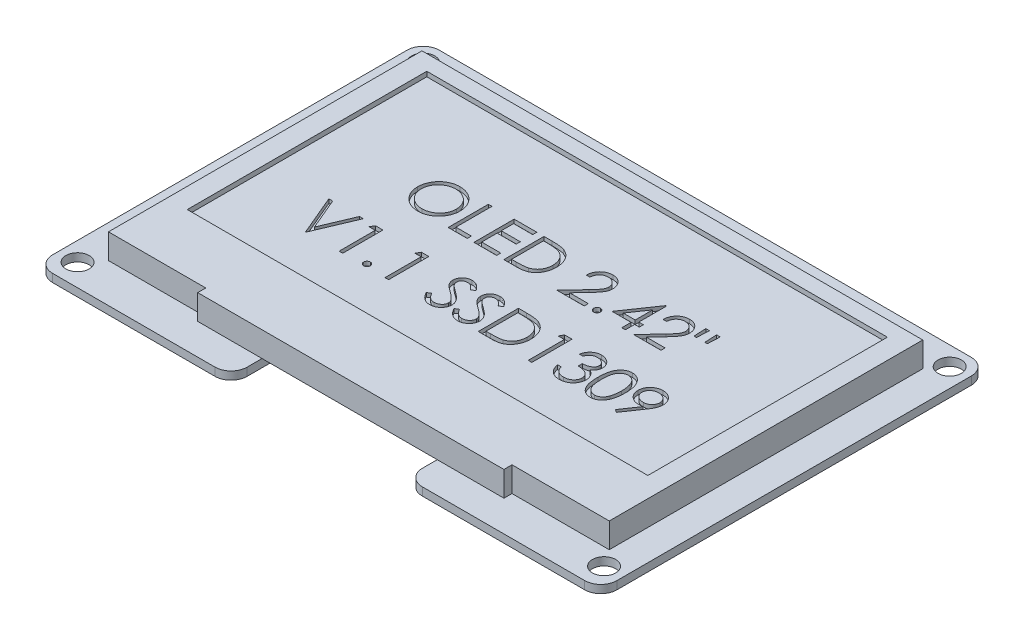
from build123d import *

# Parameters (mm, degrees)
BOSS_EXTRUDE1_DEPTH = 1
BOSS_EXTRUDE2_DEPTH = 3.1
CUT_EXTRUDE1_REACH  = 44.662
SKETCH3_R           = 1.45
SKETCH4_W           = 17.6
SKETCH4_H           = 4.6
BOSS_EXTRUDE3_DEPTH = 2
BOSS_EXTRUDE4_DEPTH = 2
SKETCH6_W           = 57.3
SKETCH6_H           = 29.8
CUT_EXTRUDE2_DEPTH  = 0.6
CUT_EXTRUDE3_DEPTH  = 0.5
SKETCH8_R           = 0.45
CUT_EXTRUDE4_DEPTH  = 43.661721719


with BuildPart() as part:
    # Sketch1 → Boss-Extrude1 (new body)
    with BuildSketch(Plane(origin=(0, 0, 0), x_dir=(1, 0, 0), z_dir=(0, 1, 0))):
        with BuildLine():
            Line((-33.1, -24.05), (-12.9, -24.05))
            ThreePointArc((-12.9, -24.05), (-11.485786438, -23.464213562), (-10.9, -22.05))
            Line((-10.9, -22.05), (-10.9, -18.82))
            ThreePointArc((-10.9, -18.82), (-10.314213562, -17.405786438), (-8.9, -16.82))
            Line((-8.9, -16.82), (8.9, -16.82))
            ThreePointArc((8.9, -16.82), (10.314213562, -17.405786438), (10.9, -18.82))
            Line((10.9, -18.82), (10.9, -22.05))
            ThreePointArc((10.9, -22.05), (11.485786438, -23.464213562), (12.9, -24.05))
            Line((12.9, -24.05), (33.1, -24.05))
            ThreePointArc((33.1, -24.05), (34.514213562, -23.464213562), (35.1, -22.05))
            Line((35.1, -22.05), (35.1, 22.05))
            ThreePointArc((35.1, 22.05), (34.514213562, 23.464213562), (33.1, 24.05))
            Line((33.1, 24.05), (-33.1, 24.05))
            ThreePointArc((-33.1, 24.05), (-34.514213562, 23.464213562), (-35.1, 22.05))
            Line((-35.1, 22.05), (-35.1, -22.05))
            ThreePointArc((-35.1, -22.05), (-34.514213562, -23.464213562), (-33.1, -24.05))
        make_face()
    extrude(amount=BOSS_EXTRUDE1_DEPTH)

    # Sketch2 → Boss-Extrude2 (add)
    with BuildSketch(Plane(origin=(0, 1, 0), x_dir=(1, 0, 0), z_dir=(0, 1, 0))):
        Polygon((31.3, 19.8), (-31, 19.8), (-31, -19.2), (-18.9, -19.2), (-18.9, -20.2), (19.2, -20.2), (19.2, -19.2), (31.3, -19.2), align=None)
    extrude(amount=BOSS_EXTRUDE2_DEPTH)

    # Sketch3 → Cut-Extrude1 (cut, up to next)
    with BuildSketch(Plane(origin=(0, 1, 0), x_dir=(1, 0, 0), z_dir=(0, 1, 0)), mode=Mode.PRIVATE) as cut_extrude1_sk1:
        with Locations((-32.75, 21.7)):
            Circle(SKETCH3_R)
    cut_extrude1_tool1 = extrude(cut_extrude1_sk1.sketch, amount=-CUT_EXTRUDE1_REACH, mode=Mode.PRIVATE) & part.part
    # Sketch3 → Cut-Extrude1 (cut, up to next)
    with BuildSketch(Plane(origin=(0, 1, 0), x_dir=(1, 0, 0), z_dir=(0, 1, 0)), mode=Mode.PRIVATE) as cut_extrude1_sk2:
        with Locations((32.75, 21.7)):
            Circle(SKETCH3_R)
    cut_extrude1_tool2 = extrude(cut_extrude1_sk2.sketch, amount=-CUT_EXTRUDE1_REACH, mode=Mode.PRIVATE) & part.part
    # Sketch3 → Cut-Extrude1 (cut, up to next)
    with BuildSketch(Plane(origin=(0, 1, 0), x_dir=(1, 0, 0), z_dir=(0, 1, 0)), mode=Mode.PRIVATE) as cut_extrude1_sk3:
        with Locations((32.75, -21.3)):
            Circle(SKETCH3_R)
    cut_extrude1_tool3 = extrude(cut_extrude1_sk3.sketch, amount=-CUT_EXTRUDE1_REACH, mode=Mode.PRIVATE) & part.part
    # Sketch3 → Cut-Extrude1 (cut, up to next)
    with BuildSketch(Plane(origin=(0, 1, 0), x_dir=(1, 0, 0), z_dir=(0, 1, 0)), mode=Mode.PRIVATE) as cut_extrude1_sk4:
        with Locations((-32.75, -21.3)):
            Circle(SKETCH3_R)
    cut_extrude1_tool4 = extrude(cut_extrude1_sk4.sketch, amount=-CUT_EXTRUDE1_REACH, mode=Mode.PRIVATE) & part.part
    add(cut_extrude1_tool1.solids().sort_by_distance((-32.75, 1, -21.7))[0], mode=Mode.SUBTRACT)
    add(cut_extrude1_tool2.solids().sort_by_distance((32.75, 1, -21.7))[0], mode=Mode.SUBTRACT)
    add(cut_extrude1_tool3.solids().sort_by_distance((32.75, 1, 21.3))[0], mode=Mode.SUBTRACT)
    add(cut_extrude1_tool4.solids().sort_by_distance((-32.75, 1, 21.3))[0], mode=Mode.SUBTRACT)

    # Sketch4 → Boss-Extrude3 (add)
    with BuildSketch(Plane.XZ):
        with Locations((0, -5.15)):
            Rectangle(SKETCH4_W, SKETCH4_H)
    extrude(amount=BOSS_EXTRUDE3_DEPTH)

    # Sketch5 → Boss-Extrude4 (add)
    with BuildSketch(Plane.XZ):
        with BuildLine():
            Line((24.1, -19.75), (17.1, -19.75))
            ThreePointArc((17.1, -19.75), (15.1, -17.75), (17.1, -15.75))
            Line((17.1, -15.75), (24.1, -15.75))
            ThreePointArc((24.1, -15.75), (26.1, -17.75), (24.1, -19.75))
        make_face()
        with BuildLine():
            Line((-17.1, -19.75), (-24.1, -19.75))
            ThreePointArc((-24.1, -19.75), (-26.1, -17.75), (-24.1, -15.75))
            Line((-24.1, -15.75), (-17.1, -15.75))
            ThreePointArc((-17.1, -15.75), (-15.1, -17.75), (-17.1, -19.75))
        make_face()
        with BuildLine():
            Line((-17.1, 15.85), (-24.1, 15.85))
            ThreePointArc((-24.1, 15.85), (-26.1, 17.85), (-24.1, 19.85))
            Line((-24.1, 19.85), (-17.1, 19.85))
            ThreePointArc((-17.1, 19.85), (-15.1, 17.85), (-17.1, 15.85))
        make_face()
        with BuildLine():
            Line((24.1, 15.85), (17.1, 15.85))
            ThreePointArc((17.1, 15.85), (15.1, 17.85), (17.1, 19.85))
            Line((17.1, 19.85), (24.1, 19.85))
            ThreePointArc((24.1, 19.85), (26.1, 17.85), (24.1, 15.85))
        make_face()
    extrude(amount=BOSS_EXTRUDE4_DEPTH)

    # Sketch6 → Cut-Extrude2 (cut)
    with BuildSketch(Plane(origin=(0, 4.1, 0), x_dir=(1, 0, 0), z_dir=(0, 1, 0))):
        with Locations((0.15, 3)):
            Rectangle(SKETCH6_W, SKETCH6_H)
    extrude(amount=-CUT_EXTRUDE2_DEPTH, mode=Mode.SUBTRACT)

    # Sketch7 → Cut-Extrude3 (cut)
    # profile 1 of 21: a face of its own
    with BuildSketch(Plane(origin=(0, 3.5, 0), x_dir=(1, 0, 0), z_dir=(0, 1, 0))):
        with BuildLine():
            add(Edge.make_bspline(
                [(-14.625641026, 8.128205128), (-14.533058017, 8.125860158), (-14.35121735, 8.121254442), (-14.083967496, 8.08599858), (-13.828831646, 8.025005166), (-13.583731448, 7.943772334), (-13.351598624, 7.835408926), (-13.13068592, 7.704430142), (-12.921518958, 7.549463773), (-12.726916984, 7.371707734), (-12.548835627, 7.1783028), (-12.391941503, 6.971905786), (-12.260452512, 6.75376464), (-12.152472816, 6.524534882), (-12.067760517, 6.284734927), (-12.00930474, 6.033086352), (-11.971964526, 5.771219652), (-11.967599129, 5.592609845), (-11.965384615, 5.502003205)],
                knots=[0, 0, 0, 0, 1.065120563, 2.091984664, 3.0946048, 4.079830382, 5.057816894, 6.036188127, 7.030412546, 8.04752943, 9.064399622, 10.05169764, 11.02544977, 11.989514704, 12.962713494, 13.945757189, 14.957906945, 16, 16, 16, 16], degree=3))
            add(Edge.make_bspline(
                [(-11.965384615, 5.502003205), (-11.967598805, 5.412063996), (-11.971963228, 5.234783395), (-12.009347196, 4.974578475), (-12.067977196, 4.724448909), (-12.151686148, 4.484812262), (-12.259151117, 4.255415742), (-12.391515647, 4.036862951), (-12.547431663, 3.829082239), (-12.724870021, 3.63434986), (-12.918300081, 3.455782045), (-13.125771891, 3.300183651), (-13.342619491, 3.166292044), (-13.57163336, 3.059458225), (-13.80977627, 2.974069767), (-14.059179588, 2.915851724), (-14.318674665, 2.878298805), (-14.495633242, 2.873986639), (-14.585576923, 2.871794872)],
                knots=[0, 0, 0, 0, 1.043624062, 2.057103931, 3.04512605, 4.022047818, 4.998200453, 5.980619268, 6.982898556, 8.009068085, 9.034988726, 10.034168286, 11.015286542, 11.987931943, 12.962482838, 13.94673481, 14.956375938, 16, 16, 16, 16], degree=3))
            add(Edge.make_bspline(
                [(-14.585576923, 2.871794872), (-14.676183093, 2.874008282), (-14.854791973, 2.878371501), (-15.116987738, 2.915773508), (-15.368813086, 2.974261085), (-15.609547874, 3.057845994), (-15.839326344, 3.165870609), (-16.058597891, 3.297591151), (-16.266482387, 3.453887067), (-16.461256311, 3.631267888), (-16.639469451, 3.824370105), (-16.794839988, 4.031276184), (-16.92659015, 4.247926836), (-17.034252053, 4.474923299), (-17.119486995, 4.711168217), (-17.177636735, 4.958237471), (-17.215259524, 5.214722479), (-17.219595019, 5.389355191), (-17.221794872, 5.477964744)],
                knots=[0, 0, 0, 0, 1.053102029, 2.075944431, 3.073151272, 4.055350789, 5.033113405, 6.020478099, 7.024410459, 8.052272461, 9.079885166, 10.07527673, 11.055994387, 12.023226415, 12.992069828, 13.970394897, 14.97016774, 16, 16, 16, 16], degree=3))
            add(Edge.make_bspline(
                [(-17.221794872, 5.477964744), (-17.221031107, 5.537439985), (-17.219513212, 5.655640162), (-17.201239366, 5.831163876), (-17.17472265, 6.003864816), (-17.136719917, 6.173251884), (-17.087017536, 6.338910434), (-17.028371783, 6.501982952), (-16.956743432, 6.660816843), (-16.875771078, 6.816164546), (-16.785397066, 6.965604411), (-16.685574567, 7.106860959), (-16.579809755, 7.241119525), (-16.46386205, 7.364900959), (-16.341552842, 7.481806183), (-16.210898016, 7.590038636), (-16.07269481, 7.69057428), (-15.926348553, 7.781174767), (-15.775465304, 7.863116388), (-15.61992705, 7.933433318), (-15.461846233, 7.993784835), (-15.30048245, 8.042700299), (-15.136264205, 8.081317493), (-14.968833084, 8.107613713), (-14.798322475, 8.125934167), (-14.683449162, 8.127444884), (-14.625641026, 8.128205128)],
                knots=[0, 0, 0, 0, 1.037015668, 2.060948919, 3.074880161, 4.083647147, 5.086022904, 6.090072063, 7.104153813, 8.122640571, 9.144368836, 10.147691507, 11.138137339, 12.123020368, 13.103399296, 14.087645067, 15.080126199, 16.082011238, 17.087798457, 18.072939717, 19.057185487, 20.037253025, 21.01195951, 21.997135196, 22.992090687, 24, 24, 24, 24], degree=3))
        make_face()
        with BuildLine():
            add(Edge.make_bspline(
                [(-14.603605769, 7.615384615), (-14.651055246, 7.614806201), (-14.745500578, 7.613654901), (-14.885907059, 7.598489593), (-15.024466964, 7.576875466), (-15.16120891, 7.546044722), (-15.295560752, 7.504038932), (-15.428774811, 7.455694778), (-15.559636317, 7.396807506), (-15.687713256, 7.330275071), (-15.811877649, 7.256633755), (-15.929038652, 7.175245517), (-16.039499571, 7.088019011), (-16.142989952, 6.994750672), (-16.239205913, 6.894965526), (-16.3300412, 6.790176332), (-16.411854889, 6.677387916), (-16.486834284, 6.559658763), (-16.553931199, 6.437142219), (-16.613595991, 6.31112813), (-16.662401718, 6.180588577), (-16.702205113, 6.046939781), (-16.735204842, 5.91039341), (-16.756110448, 5.769913626), (-16.77144239, 5.626206323), (-16.772527884, 5.529089388), (-16.773076923, 5.479967949)],
                knots=[0, 0, 0, 0, 1.008559885, 2.007477868, 2.99961109, 3.989939068, 4.984837346, 5.991145699, 7.001802488, 8.033829008, 9.059044045, 10.069351652, 11.065060232, 12.050310815, 13.029377138, 14.011219647, 14.996725999, 15.989392538, 16.977580475, 17.965360261, 18.951710183, 19.937753436, 20.929683414, 21.935841486, 22.955955122, 24, 24, 24, 24], degree=3))
            add(Edge.make_bspline(
                [(-16.773076923, 5.479967949), (-16.771255692, 5.407736205), (-16.767672766, 5.265634019), (-16.736304809, 5.057393813), (-16.687987703, 4.85726769), (-16.616762893, 4.666350676), (-16.527690587, 4.483001701), (-16.417652172, 4.308847266), (-16.28728205, 4.143840302), (-16.139191297, 3.989132775), (-15.977301717, 3.847924483), (-15.805397817, 3.723976757), (-15.625321235, 3.619104971), (-15.436602374, 3.533669154), (-15.240248746, 3.465969528), (-15.034995102, 3.419571484), (-14.822208731, 3.389035119), (-14.677164938, 3.386102611), (-14.603605769, 3.384615385)],
                knots=[0, 0, 0, 0, 1.032063989, 2.030389145, 3.003944642, 3.970395727, 4.937377036, 5.913328081, 6.909231446, 7.93887556, 8.970685674, 9.976071282, 10.964166581, 11.944589148, 12.933237628, 13.927779006, 14.949070134, 16, 16, 16, 16], degree=3))
            add(Edge.make_bspline(
                [(-14.603605769, 3.384615385), (-14.554163624, 3.385294677), (-14.456105001, 3.386641917), (-14.310254254, 3.400211455), (-14.167031095, 3.421971268), (-14.026636409, 3.453300776), (-13.889229536, 3.492511071), (-13.75423696, 3.53909354), (-13.623096545, 3.597209545), (-13.49415392, 3.661420904), (-13.370730717, 3.734621129), (-13.252908528, 3.813247058), (-13.143657129, 3.900345087), (-13.040244169, 3.992227676), (-12.943633185, 4.090747459), (-12.854477493, 4.195776347), (-12.773077305, 4.307977286), (-12.698126381, 4.425527866), (-12.631264577, 4.548379656), (-12.573008721, 4.674850624), (-12.523585699, 4.804629352), (-12.483687835, 4.937903025), (-12.452422889, 5.074418524), (-12.430880147, 5.214358635), (-12.415810948, 5.35744341), (-12.414675124, 5.454220347), (-12.414102564, 5.503004808)],
                knots=[0, 0, 0, 0, 1.047197238, 2.076906641, 3.100256066, 4.114471768, 5.12198147, 6.126382909, 7.136867548, 8.15857795, 9.17633901, 10.174870724, 11.156907918, 12.133735059, 13.104061851, 14.077631395, 15.04955518, 16.038496417, 17.029181396, 18.010275684, 18.986308667, 19.968651475, 20.955262928, 21.950658345, 22.966943676, 24, 24, 24, 24], degree=3))
            add(Edge.make_bspline(
                [(-12.414102564, 5.503004808), (-12.414675583, 5.551455528), (-12.41581227, 5.647566457), (-12.430872949, 5.78965334), (-12.452445649, 5.9285865), (-12.483535232, 6.063820504), (-12.52360688, 6.195389825), (-12.573017352, 6.323170893), (-12.631282066, 6.447639744), (-12.698150958, 6.568488739), (-12.77331642, 6.684452651), (-12.855451053, 6.79531324), (-12.945972979, 6.898988585), (-13.042295872, 6.998038148), (-13.146825708, 7.090349419), (-13.259088985, 7.175953019), (-13.37772281, 7.25691484), (-13.503333147, 7.329951357), (-13.632967366, 7.397400261), (-13.765987306, 7.455187408), (-13.90088602, 7.504290436), (-14.037320466, 7.546171814), (-14.176439007, 7.576754715), (-14.317301619, 7.598509072), (-14.459713417, 7.613649623), (-14.555489446, 7.614804449), (-14.603605769, 7.615384615)],
                knots=[0, 0, 0, 0, 1.02996197, 2.043119294, 3.035359645, 4.018872909, 4.991431989, 5.957985074, 6.929999688, 7.912076566, 8.892894881, 9.867085534, 10.843653904, 11.817741046, 12.803660682, 13.806313499, 14.818574707, 15.856120519, 16.894564902, 17.924820532, 18.937903209, 19.946497019, 20.957711757, 21.963978472, 22.977135795, 24, 24, 24, 24], degree=3))
        make_face(mode=Mode.SUBTRACT)
    # profile 2 of 21: a face of its own
    with BuildSketch(Plane(origin=(0, 3.5, 0), x_dir=(1, 0, 0), z_dir=(0, 1, 0))):
        Polygon((-10.93974359, 8), (-10.491025641, 8), (-10.491025641, 3.512820513), (-8.567948718, 3.512820513), (-8.567948718, 3), (-10.93974359, 3), align=None)
    # profile 3 of 21: a face of its own
    with BuildSketch(Plane(origin=(0, 3.5, 0), x_dir=(1, 0, 0), z_dir=(0, 1, 0))):
        Polygon((-7.734615385, 8), (-4.914102564, 8), (-4.914102564, 7.487179487), (-7.285897436, 7.487179487), (-7.285897436, 5.948717949), (-4.914102564, 5.948717949), (-4.914102564, 5.435897436), (-7.285897436, 5.435897436), (-7.285897436, 3.512820513), (-4.914102564, 3.512820513), (-4.914102564, 3), (-7.734615385, 3), align=None)
    # profile 4 of 21: a face of its own
    with BuildSketch(Plane(origin=(0, 3.5, 0), x_dir=(1, 0, 0), z_dir=(0, 1, 0))):
        with BuildLine():
            Line((-4.016666667, 3), (-4.016666667, 8))
            Line((-4.016666667, 8), (-3.007051282, 8))
            add(Edge.make_bspline(
                [(-3.007051282, 8), (-2.919238442, 7.999367757), (-2.749584491, 7.998146267), (-2.504423852, 7.990401423), (-2.277589906, 7.976700757), (-2.069828678, 7.956744291), (-1.880569804, 7.932239958), (-1.710343221, 7.901525094), (-1.558268731, 7.865256279), (-1.464740959, 7.834334208), (-1.420512821, 7.819711538)],
                knots=[0, 0, 0, 0, 1.314313732, 2.53924729, 3.670748893, 4.714932338, 5.66265055, 6.526160246, 7.303039223, 8, 8, 8, 8], degree=3))
            add(Edge.make_bspline(
                [(-1.420512821, 7.819711538), (-1.362663193, 7.797667673), (-1.248275775, 7.754079825), (-1.085408457, 7.671856537), (-0.93208651, 7.578694963), (-0.787487732, 7.474472302), (-0.654915123, 7.356237518), (-0.529189556, 7.22901311), (-0.415454236, 7.088172624), (-0.311299528, 6.936636927), (-0.217391443, 6.776191138), (-0.135764074, 6.607140983), (-0.067972655, 6.430344972), (-0.011696617, 6.24629476), (0.032655465, 6.054585649), (0.062915367, 5.854994412), (0.082873924, 5.648309856), (0.084879712, 5.508060622), (0.085897436, 5.436899038)],
                knots=[0, 0, 0, 0, 0.984719456, 1.947108742, 2.898477687, 3.838006223, 4.779231079, 5.722358779, 6.681677486, 7.655904652, 8.64651281, 9.637519902, 10.640069247, 11.656948941, 12.698408672, 13.768548281, 14.867775369, 16, 16, 16, 16], degree=3))
            add(Edge.make_bspline(
                [(0.085897436, 5.436899038), (0.084998911, 5.375097269), (0.083228274, 5.253310428), (0.067329251, 5.073823434), (0.044220222, 4.899661189), (0.008442797, 4.731653046), (-0.034989365, 4.568327021), (-0.090652438, 4.411423815), (-0.154417433, 4.259504087), (-0.228774402, 4.114621979), (-0.310404952, 3.977360018), (-0.398007443, 3.847966407), (-0.491488436, 3.728287518), (-0.59173934, 3.61796093), (-0.697464649, 3.51715296), (-0.80935655, 3.42502151), (-0.927703766, 3.343369289), (-1.051976227, 3.268987706), (-1.185799268, 3.204101483), (-1.331707649, 3.149201469), (-1.490323617, 3.103706305), (-1.661257841, 3.065747882), (-1.844805667, 3.03563745), (-2.041147047, 3.015456889), (-2.249980318, 3.001809842), (-2.393379268, 3.000614995), (-2.4671875, 3)],
                knots=[0, 0, 0, 0, 1.105936401, 2.179363191, 3.223086493, 4.248585256, 5.251745608, 6.245858792, 7.225916811, 8.198733463, 9.158002045, 10.082870192, 10.993790845, 11.873723703, 12.748670949, 13.606408763, 14.465103618, 15.319838547, 16.196477973, 17.123216899, 18.106603292, 19.147568657, 20.255746949, 21.433717677, 22.679120308, 24, 24, 24, 24], degree=3))
            Line((-2.4671875, 3), (-4.016666667, 3))
        make_face()
        with BuildLine():
            Line((-3.567948718, 3.512820513), (-2.994030449, 3.512820513))
            add(Edge.make_bspline(
                [(-2.994030449, 3.512820513), (-2.911561348, 3.513174936), (-2.752943064, 3.513856622), (-2.524860211, 3.519838341), (-2.316461073, 3.529612537), (-2.12771606, 3.54329122), (-1.958731739, 3.561389242), (-1.809154954, 3.581567674), (-1.679476013, 3.60670689), (-1.601005389, 3.629493974), (-1.56474359, 3.640024038)],
                knots=[0, 0, 0, 0, 1.375205317, 2.645023457, 3.804390687, 4.853969522, 5.800190428, 6.637939096, 7.370582563, 8, 8, 8, 8], degree=3))
            add(Edge.make_bspline(
                [(-1.56474359, 3.640024038), (-1.519103072, 3.656097693), (-1.428912161, 3.687861083), (-1.299082039, 3.745800599), (-1.178000604, 3.814432128), (-1.063557711, 3.89072109), (-0.957376774, 3.977358236), (-0.858199465, 4.072459649), (-0.766225463, 4.176509327), (-0.682405023, 4.28937813), (-0.60739316, 4.410363552), (-0.542434261, 4.538276172), (-0.485503502, 4.671714472), (-0.440819798, 4.812727556), (-0.405797535, 4.960054782), (-0.380990838, 5.113706515), (-0.365541232, 5.273654061), (-0.363739163, 5.38244281), (-0.362820513, 5.437900641)],
                knots=[0, 0, 0, 0, 0.998632004, 1.973411704, 2.929992603, 3.868527914, 4.809262121, 5.754881198, 6.702106254, 7.672490631, 8.653608572, 9.636854334, 10.631411391, 11.644891563, 12.686317036, 13.754757253, 14.855430412, 16, 16, 16, 16], degree=3))
            add(Edge.make_bspline(
                [(-0.362820513, 5.437900641), (-0.36355378, 5.496377041), (-0.364994291, 5.611254448), (-0.383100449, 5.779812584), (-0.409559814, 5.941927799), (-0.447822223, 6.097610935), (-0.496580621, 6.247165724), (-0.557430109, 6.389765024), (-0.626953851, 6.526914837), (-0.709672904, 6.655449645), (-0.800266608, 6.77701123), (-0.900806436, 6.888375395), (-1.009695063, 6.989795824), (-1.125744848, 7.082851985), (-1.252226418, 7.163800093), (-1.386160262, 7.236209637), (-1.529511221, 7.297660911), (-1.629243643, 7.330345), (-1.679927885, 7.346955128)],
                knots=[0, 0, 0, 0, 1.122418816, 2.205001699, 3.251619955, 4.274784885, 5.280384055, 6.268708349, 7.249350384, 8.229342522, 9.199999885, 10.157847722, 11.105861043, 12.055065948, 13.010012805, 13.98527497, 14.976112212, 16, 16, 16, 16], degree=3))
            add(Edge.make_bspline(
                [(-1.679927885, 7.346955128), (-1.721858094, 7.358550025), (-1.811013223, 7.383203957), (-1.956498171, 7.410097347), (-2.120234099, 7.43381806), (-2.302947958, 7.453900973), (-2.504431471, 7.468311432), (-2.724839596, 7.479127596), (-2.964267603, 7.486422785), (-3.130242651, 7.486920938), (-3.216386218, 7.487179487)],
                knots=[0, 0, 0, 0, 0.674548936, 1.434276114, 2.292660221, 3.240891867, 4.284742987, 5.42552168, 6.663806718, 8, 8, 8, 8], degree=3))
            Line((-3.216386218, 7.487179487), (-3.567948718, 7.487179487))
            Line((-3.567948718, 7.487179487), (-3.567948718, 3.512820513))
        make_face(mode=Mode.SUBTRACT)
    # profile 5 of 21: a face of its own
    with BuildSketch(Plane(origin=(0, 3.5, 0), x_dir=(1, 0, 0), z_dir=(0, 1, 0))):
        with BuildLine():
            Line((3.226923077, 6.461538462), (2.778205128, 6.461538462))
            add(Edge.make_bspline(
                [(2.778205128, 6.461538462), (2.781129633, 6.521068301), (2.786873281, 6.637983322), (2.813770837, 6.808446045), (2.852257805, 6.971381472), (2.906674168, 7.125481349), (2.974254564, 7.272108217), (3.055297461, 7.410679668), (3.151288676, 7.54066708), (3.260155439, 7.660865428), (3.378396351, 7.771133386), (3.505976265, 7.866355162), (3.64004059, 7.946808978), (3.780182588, 8.014067895), (3.927983393, 8.064553389), (4.082101762, 8.102012874), (4.243214814, 8.124550511), (4.352986274, 8.126973062), (4.408814103, 8.128205128)],
                knots=[0, 0, 0, 0, 1.10065271, 2.161652631, 3.183658789, 4.190468796, 5.17591951, 6.163126047, 7.15150782, 8.156236427, 9.156009102, 10.134482811, 11.092018607, 12.041330605, 13.001268258, 13.972401359, 14.968799086, 16, 16, 16, 16], degree=3))
            add(Edge.make_bspline(
                [(4.408814103, 8.128205128), (4.463639923, 8.126921619), (4.571370701, 8.124399569), (4.72860215, 8.102740956), (4.878283999, 8.068818682), (5.020123666, 8.02122523), (5.152989472, 7.957247477), (5.277879536, 7.88039385), (5.396280694, 7.791508377), (5.502861814, 7.686860072), (5.600730498, 7.57514238), (5.685162291, 7.455873946), (5.757466811, 7.332689252), (5.817734925, 7.204648964), (5.862100837, 7.070547495), (5.895783992, 6.932337205), (5.914823154, 6.788587475), (5.917745188, 6.691292396), (5.919230769, 6.641826923)],
                knots=[0, 0, 0, 0, 1.111607364, 2.184268762, 3.212621178, 4.221274766, 5.211760367, 6.196651075, 7.1921475, 8.207485113, 9.220403448, 10.201281604, 11.166441695, 12.114753415, 13.065576456, 14.026450734, 14.996634279, 16, 16, 16, 16], degree=3))
            add(Edge.make_bspline(
                [(5.919230769, 6.641826923), (5.916811822, 6.572187159), (5.912016378, 6.434129711), (5.87099584, 6.231251336), (5.806929395, 6.034689309), (5.729790314, 5.876493163), (5.651972537, 5.749016743), (5.581847526, 5.64406145), (5.499754939, 5.531053638), (5.404499942, 5.410371728), (5.298052981, 5.281070435), (5.179449891, 5.14322787), (5.047844917, 4.998268199), (4.95547563, 4.899260197), (4.907612179, 4.847956731)],
                knots=[0, 0, 0, 0, 1.184426356, 2.348067706, 3.509069118, 4.696110526, 5.333549288, 6.050745305, 6.844228056, 7.710549037, 8.667450064, 9.695053472, 10.805634456, 12, 12, 12, 12], degree=3))
            Line((4.907612179, 4.847956731), (3.656610577, 3.512820513))
            Line((3.656610577, 3.512820513), (5.983333333, 3.512820513))
            Line((5.983333333, 3.512820513), (5.983333333, 3))
            Line((5.983333333, 3), (2.585897436, 3))
            Line((2.585897436, 3), (4.525, 5.069310897))
            add(Edge.make_bspline(
                [(4.525, 5.069310897), (4.572211267, 5.118594193), (4.662894448, 5.213257316), (4.791155272, 5.351461545), (4.906353827, 5.479675175), (5.009235817, 5.597655958), (5.097569396, 5.707129626), (5.175958299, 5.804550632), (5.238766286, 5.894199846), (5.306931137, 5.998115009), (5.37295111, 6.124989748), (5.429683047, 6.280037875), (5.464275688, 6.439648236), (5.468425453, 6.547508289), (5.470512821, 6.601762821)],
                knots=[0, 0, 0, 0, 1.329631726, 2.553950428, 3.673215718, 4.687767853, 5.603093632, 6.413772471, 7.123043292, 7.734684054, 8.834405432, 9.900288307, 10.943827018, 12, 12, 12, 12], degree=3))
            add(Edge.make_bspline(
                [(5.470512821, 6.601762821), (5.469604617, 6.635879104), (5.467814723, 6.703115747), (5.452018012, 6.801695403), (5.428145861, 6.896787994), (5.393938349, 6.988686022), (5.348785863, 7.076465524), (5.293823892, 7.160233353), (5.230409516, 7.241217589), (5.15705056, 7.317150872), (5.076462674, 7.386695452), (4.991328032, 7.448301288), (4.901256454, 7.499785732), (4.806627708, 7.541990728), (4.707705609, 7.575098415), (4.60429883, 7.598039243), (4.496693093, 7.612442792), (4.42321667, 7.614391609), (4.385777244, 7.615384615)],
                knots=[0, 0, 0, 0, 0.991446411, 1.95395049, 2.89581595, 3.838931463, 4.798493298, 5.75982156, 6.748411868, 7.785213223, 8.824556874, 9.840280684, 10.836137867, 11.835679398, 12.848801643, 13.863922112, 14.911575587, 16, 16, 16, 16], degree=3))
            add(Edge.make_bspline(
                [(4.385777244, 7.615384615), (4.346676054, 7.614363141), (4.269887774, 7.612357133), (4.157146298, 7.598324756), (4.049595187, 7.574116413), (3.946963897, 7.541006878), (3.849078775, 7.498923237), (3.756415855, 7.446506458), (3.669183156, 7.383958611), (3.587216694, 7.313043531), (3.511696724, 7.234089815), (3.445344044, 7.146075582), (3.387366881, 7.050607845), (3.336782262, 6.947944202), (3.295702704, 6.837153087), (3.264312489, 6.718627795), (3.239474137, 6.592882964), (3.23117625, 6.506047129), (3.226923077, 6.461538462)],
                knots=[0, 0, 0, 0, 1.031018746, 2.02475058, 2.990194455, 3.934040569, 4.864654155, 5.795059489, 6.735614925, 7.690564532, 8.649604399, 9.611025574, 10.590972636, 11.591080095, 12.624614302, 13.701020113, 14.821632451, 16, 16, 16, 16], degree=3))
        make_face()
    # profile 6 of 21: a face of its own
    with BuildSketch(Plane(origin=(0, 3.5, 0), x_dir=(1, 0, 0), z_dir=(0, 1, 0))):
        with BuildLine():
            add(Edge.make_bspline(
                [(7.233333333, 3.769230769), (7.261176494, 3.767576245), (7.315759754, 3.764332745), (7.394672795, 3.742080354), (7.466093737, 3.702567982), (7.52971123, 3.64990687), (7.582149053, 3.586055922), (7.623069556, 3.515204624), (7.645128107, 3.43563092), (7.648347981, 3.380731385), (7.65, 3.352564103)],
                knots=[0, 0, 0, 0, 1.020151414, 1.999887582, 2.974338812, 3.990962822, 5.007586832, 5.987933904, 6.967670073, 8, 8, 8, 8], degree=3))
            add(Edge.make_bspline(
                [(7.65, 3.352564103), (7.648291999, 3.325073631), (7.644923846, 3.270862826), (7.62312012, 3.191889308), (7.581837191, 3.12099373), (7.530072916, 3.05627639), (7.46607801, 3.003503718), (7.394503944, 2.964327511), (7.315945004, 2.940481826), (7.261207399, 2.937444258), (7.233333333, 2.935897436)],
                knots=[0, 0, 0, 0, 1.009421747, 1.99056486, 2.972319754, 3.999869655, 5.017953583, 5.993804169, 6.978383603, 8, 8, 8, 8], degree=3))
            add(Edge.make_bspline(
                [(7.233333333, 2.935897436), (7.205439182, 2.937388289), (7.150982493, 2.940298825), (7.072716787, 2.964817119), (7.000706832, 3.003136348), (6.936724386, 3.056374791), (6.88452657, 3.12066071), (6.845061737, 3.192377562), (6.821361524, 3.270636758), (6.818244564, 3.325029105), (6.816666667, 3.352564103)],
                knots=[0, 0, 0, 0, 1.022052826, 1.995314843, 2.982371812, 4.00089066, 5.028879526, 6.005146991, 6.990147033, 8, 8, 8, 8], degree=3))
            add(Edge.make_bspline(
                [(6.816666667, 3.352564103), (6.818183951, 3.380777502), (6.821146263, 3.435860702), (6.845111492, 3.51471657), (6.884220366, 3.586385769), (6.937085216, 3.649809455), (7.000691353, 3.702934173), (7.072543075, 3.741598163), (7.15117099, 3.764513038), (7.205470902, 3.767630919), (7.233333333, 3.769230769)],
                knots=[0, 0, 0, 0, 1.032775665, 2.016367738, 2.991239715, 4.008302682, 5.025365648, 6.011011707, 6.979408107, 8, 8, 8, 8], degree=3))
        make_face()
    # profile 7 of 21: a face of its own
    with BuildSketch(Plane(origin=(0, 3.5, 0), x_dir=(1, 0, 0), z_dir=(0, 1, 0))):
        Polygon((11.020392628, 8.128205128), (11.111538462, 8.128205128), (11.111538462, 4.666666667), (11.688461538, 4.666666667), (11.688461538, 4.153846154), (11.111538462, 4.153846154), (11.111538462, 3), (10.662820513, 3), (10.662820513, 4.153846154), (8.291025641, 4.153846154), align=None)
        Polygon((10.662820513, 4.666666667), (10.662820513, 6.838141026), (9.172435897, 4.666666667), align=None, mode=Mode.SUBTRACT)
    # profile 8 of 21: a face of its own
    with BuildSketch(Plane(origin=(0, 3.5, 0), x_dir=(1, 0, 0), z_dir=(0, 1, 0))):
        with BuildLine():
            Line((12.778205128, 6.461538462), (12.329487179, 6.461538462))
            add(Edge.make_bspline(
                [(12.329487179, 6.461538462), (12.332411684, 6.521068301), (12.338155332, 6.637983322), (12.365052888, 6.808446045), (12.403539856, 6.971381472), (12.457956219, 7.125481349), (12.525536616, 7.272108217), (12.606579512, 7.410679668), (12.702570727, 7.54066708), (12.81143749, 7.660865428), (12.929678403, 7.771133386), (13.057258316, 7.866355162), (13.191322641, 7.946808978), (13.331464639, 8.014067895), (13.479265445, 8.064553389), (13.633383813, 8.102012874), (13.794496865, 8.124550511), (13.904268325, 8.126973062), (13.960096154, 8.128205128)],
                knots=[0, 0, 0, 0, 1.10065271, 2.161652631, 3.183658789, 4.190468796, 5.17591951, 6.163126047, 7.15150782, 8.156236427, 9.156009102, 10.134482811, 11.092018607, 12.041330605, 13.001268258, 13.972401359, 14.968799086, 16, 16, 16, 16], degree=3))
            add(Edge.make_bspline(
                [(13.960096154, 8.128205128), (14.014921974, 8.126921619), (14.122652752, 8.124399569), (14.279884201, 8.102740956), (14.429566051, 8.068818682), (14.571405717, 8.02122523), (14.704271523, 7.957247477), (14.829161587, 7.88039385), (14.947562745, 7.791508377), (15.054143865, 7.686860072), (15.152012549, 7.57514238), (15.236444343, 7.455873946), (15.308748862, 7.332689252), (15.369016976, 7.204648964), (15.413382889, 7.070547495), (15.447066043, 6.932337205), (15.466105205, 6.788587475), (15.469027239, 6.691292396), (15.470512821, 6.641826923)],
                knots=[0, 0, 0, 0, 1.111607364, 2.184268762, 3.212621178, 4.221274766, 5.211760367, 6.196651075, 7.1921475, 8.207485113, 9.220403448, 10.201281604, 11.166441695, 12.114753415, 13.065576456, 14.026450734, 14.996634279, 16, 16, 16, 16], degree=3))
            add(Edge.make_bspline(
                [(15.470512821, 6.641826923), (15.468093874, 6.572187159), (15.463298429, 6.434129711), (15.422277891, 6.231251336), (15.358211446, 6.034689309), (15.281072365, 5.876493163), (15.203254588, 5.749016743), (15.133129577, 5.64406145), (15.05103699, 5.531053638), (14.955781993, 5.410371728), (14.849335033, 5.281070435), (14.730731942, 5.14322787), (14.599126968, 4.998268199), (14.506757681, 4.899260197), (14.458894231, 4.847956731)],
                knots=[0, 0, 0, 0, 1.184426356, 2.348067706, 3.509069118, 4.696110526, 5.333549288, 6.050745305, 6.844228056, 7.710549037, 8.667450064, 9.695053472, 10.805634456, 12, 12, 12, 12], degree=3))
            Line((14.458894231, 4.847956731), (13.207892628, 3.512820513))
            Line((13.207892628, 3.512820513), (15.534615385, 3.512820513))
            Line((15.534615385, 3.512820513), (15.534615385, 3))
            Line((15.534615385, 3), (12.137179487, 3))
            Line((12.137179487, 3), (14.076282051, 5.069310897))
            add(Edge.make_bspline(
                [(14.076282051, 5.069310897), (14.123493318, 5.118594193), (14.2141765, 5.213257316), (14.342437324, 5.351461545), (14.457635878, 5.479675175), (14.560517868, 5.597655958), (14.648851447, 5.707129626), (14.72724035, 5.804550632), (14.790048337, 5.894199846), (14.858213188, 5.998115009), (14.924233162, 6.124989748), (14.980965099, 6.280037875), (15.015557739, 6.439648236), (15.019707504, 6.547508289), (15.021794872, 6.601762821)],
                knots=[0, 0, 0, 0, 1.329631726, 2.553950428, 3.673215718, 4.687767853, 5.603093632, 6.413772471, 7.123043292, 7.734684054, 8.834405432, 9.900288307, 10.943827018, 12, 12, 12, 12], degree=3))
            add(Edge.make_bspline(
                [(15.021794872, 6.601762821), (15.020886669, 6.635879104), (15.019096774, 6.703115747), (15.003300064, 6.801695403), (14.979427912, 6.896787994), (14.9452204, 6.988686022), (14.900067915, 7.076465524), (14.845105943, 7.160233353), (14.781691567, 7.241217589), (14.708332611, 7.317150872), (14.627744725, 7.386695452), (14.542610083, 7.448301288), (14.452538506, 7.499785732), (14.35790976, 7.541990728), (14.25898766, 7.575098415), (14.155580882, 7.598039243), (14.047975144, 7.612442792), (13.974498722, 7.614391609), (13.937059295, 7.615384615)],
                knots=[0, 0, 0, 0, 0.991446411, 1.95395049, 2.89581595, 3.838931463, 4.798493298, 5.75982156, 6.748411868, 7.785213223, 8.824556874, 9.840280684, 10.836137867, 11.835679398, 12.848801643, 13.863922112, 14.911575587, 16, 16, 16, 16], degree=3))
            add(Edge.make_bspline(
                [(13.937059295, 7.615384615), (13.897958105, 7.614363141), (13.821169825, 7.612357133), (13.708428349, 7.598324756), (13.600877239, 7.574116413), (13.498245949, 7.541006878), (13.400360826, 7.498923237), (13.307697906, 7.446506458), (13.220465207, 7.383958611), (13.138498745, 7.313043531), (13.062978775, 7.234089815), (12.996626095, 7.146075582), (12.938648932, 7.050607845), (12.888064313, 6.947944202), (12.846984756, 6.837153087), (12.815594541, 6.718627795), (12.790756188, 6.592882964), (12.782458302, 6.506047129), (12.778205128, 6.461538462)],
                knots=[0, 0, 0, 0, 1.031018746, 2.02475058, 2.990194455, 3.934040569, 4.864654155, 5.795059489, 6.735614925, 7.690564532, 8.649604399, 9.611025574, 10.590972636, 11.591080095, 12.624614302, 13.701020113, 14.821632451, 16, 16, 16, 16], degree=3))
        make_face()
    # profile 9 of 21: a face of its own
    with BuildSketch(Plane(origin=(0, 3.5, 0), x_dir=(1, 0, 0), z_dir=(0, 1, 0))):
        Polygon((17.708092949, 6.58974359), (17.396594551, 6.58974359), (17.329487179, 8.128205128), (17.778205128, 8.128205128), align=None)
    # profile 10 of 21: a face of its own
    with BuildSketch(Plane(origin=(0, 3.5, 0), x_dir=(1, 0, 0), z_dir=(0, 1, 0))):
        Polygon((16.36494391, 6.58974359), (16.050440705, 6.58974359), (15.983333333, 8.128205128), (16.432051282, 8.128205128), align=None)
    # profile 11 of 21: a face of its own
    with BuildSketch(Plane(origin=(0, 3.5, 0), x_dir=(1, 0, 0), z_dir=(0, 1, 0))):
        Polygon((-21.452564103, -1.333333333), (-20.971794872, -1.333333333), (-19.305128205, -5.273637821), (-17.638461538, -1.333333333), (-17.157692308, -1.333333333), (-19.273076923, -6.333333333), (-19.337179487, -6.333333333), align=None)
    # profile 12 of 21: a face of its own
    with BuildSketch(Plane(origin=(0, 3.5, 0), x_dir=(1, 0, 0), z_dir=(0, 1, 0))):
        Polygon((-15.646274038, -1.333333333), (-14.721794872, -1.333333333), (-14.721794872, -6.333333333), (-15.170512821, -6.333333333), (-15.170512821, -1.846153846), (-15.93974359, -1.846153846), align=None)
    # profile 13 of 21: a face of its own
    with BuildSketch(Plane(origin=(0, 3.5, 0), x_dir=(1, 0, 0), z_dir=(0, 1, 0))):
        with BuildLine():
            add(Edge.make_bspline(
                [(-12.061538462, -5.564102564), (-12.033695301, -5.565757088), (-11.979112041, -5.569000588), (-11.900199, -5.59125298), (-11.828778058, -5.630765352), (-11.765160565, -5.683426464), (-11.712722742, -5.747277411), (-11.671802239, -5.818128709), (-11.649743688, -5.897702413), (-11.646523814, -5.952601948), (-11.644871795, -5.980769231)],
                knots=[0, 0, 0, 0, 1.020151414, 1.999887582, 2.974338812, 3.990962822, 5.007586832, 5.987933904, 6.967670073, 8, 8, 8, 8], degree=3))
            add(Edge.make_bspline(
                [(-11.644871795, -5.980769231), (-11.646579796, -6.008259702), (-11.649947949, -6.062470507), (-11.671751675, -6.141444025), (-11.713034604, -6.212339603), (-11.764798879, -6.277056943), (-11.828793784, -6.329829615), (-11.900367851, -6.369005822), (-11.978926791, -6.392851508), (-12.033664396, -6.395889075), (-12.061538462, -6.397435897)],
                knots=[0, 0, 0, 0, 1.009421747, 1.99056486, 2.972319754, 3.999869655, 5.017953583, 5.993804169, 6.978383603, 8, 8, 8, 8], degree=3))
            add(Edge.make_bspline(
                [(-12.061538462, -6.397435897), (-12.089432612, -6.395945044), (-12.143889302, -6.393034509), (-12.222155008, -6.368516214), (-12.294164963, -6.330196985), (-12.358147408, -6.276958543), (-12.410345225, -6.212672624), (-12.449810058, -6.140955772), (-12.47351027, -6.062696575), (-12.476627231, -6.008304228), (-12.478205128, -5.980769231)],
                knots=[0, 0, 0, 0, 1.022052826, 1.995314843, 2.982371812, 4.00089066, 5.028879526, 6.005146991, 6.990147033, 8, 8, 8, 8], degree=3))
            add(Edge.make_bspline(
                [(-12.478205128, -5.980769231), (-12.476687844, -5.952555831), (-12.473725531, -5.897472631), (-12.449760303, -5.818616763), (-12.410651428, -5.746947565), (-12.357786578, -5.683523879), (-12.294180441, -5.630399161), (-12.22232872, -5.59173517), (-12.143700805, -5.568820296), (-12.089400893, -5.565702415), (-12.061538462, -5.564102564)],
                knots=[0, 0, 0, 0, 1.032775665, 2.016367738, 2.991239715, 4.008302682, 5.025365648, 6.011011707, 6.979408107, 8, 8, 8, 8], degree=3))
        make_face()
    # profile 14 of 21: a face of its own
    with BuildSketch(Plane(origin=(0, 3.5, 0), x_dir=(1, 0, 0), z_dir=(0, 1, 0))):
        Polygon((-9.941145833, -1.333333333), (-9.016666667, -1.333333333), (-9.016666667, -6.333333333), (-9.465384615, -6.333333333), (-9.465384615, -1.846153846), (-10.234615385, -1.846153846), align=None)
    # profile 15 of 21: a face of its own
    with BuildSketch(Plane(origin=(0, 3.5, 0), x_dir=(1, 0, 0), z_dir=(0, 1, 0))):
        with BuildLine():
            Line((-5.298717949, -5.368790064), (-4.876041667, -5.115384615))
            add(Edge.make_bspline(
                [(-4.876041667, -5.115384615), (-4.836729899, -5.18119088), (-4.76141007, -5.307273142), (-4.635765271, -5.477641772), (-4.505575398, -5.622444853), (-4.36987635, -5.740840006), (-4.229496424, -5.834052702), (-4.083519204, -5.90005589), (-3.932436618, -5.941221569), (-3.829616873, -5.946221692), (-3.778285256, -5.948717949)],
                knots=[0, 0, 0, 0, 1.272034388, 2.437168799, 3.508375237, 4.49857839, 5.41946034, 6.295179144, 7.148887113, 8, 8, 8, 8], degree=3))
            add(Edge.make_bspline(
                [(-3.778285256, -5.948717949), (-3.734446884, -5.947496988), (-3.647537208, -5.94507643), (-3.519591147, -5.921818142), (-3.39533143, -5.886086529), (-3.27731909, -5.83491377), (-3.167182498, -5.773001647), (-3.070601504, -5.698221394), (-2.987107057, -5.614498243), (-2.918808322, -5.52109445), (-2.866408272, -5.420641381), (-2.826133888, -5.317532879), (-2.803783783, -5.21014921), (-2.800416992, -5.137848549), (-2.798717949, -5.101362179)],
                knots=[0, 0, 0, 0, 1.095163259, 2.171163733, 3.241058638, 4.321873601, 5.38011039, 6.391990106, 7.366004449, 8.327778327, 9.272591725, 10.192022065, 11.087607919, 12, 12, 12, 12], degree=3))
            add(Edge.make_bspline(
                [(-2.798717949, -5.101362179), (-2.800824107, -5.059732394), (-2.805105619, -4.975105124), (-2.841293447, -4.850248477), (-2.898220943, -4.726687663), (-2.950739005, -4.650257283), (-2.978004808, -4.610576923)],
                knots=[0, 0, 0, 0, 0.938893495, 1.908633276, 2.914225137, 4, 4, 4, 4], degree=3))
            add(Edge.make_bspline(
                [(-2.978004808, -4.610576923), (-3.000391399, -4.581938604), (-3.047389248, -4.521816034), (-3.128185695, -4.432322841), (-3.22299443, -4.340010814), (-3.328570937, -4.241355018), (-3.448761064, -4.14094388), (-3.57980037, -4.033989197), (-3.725034454, -3.924558373), (-3.826890878, -3.851168993), (-3.879447115, -3.813301282)],
                knots=[0, 0, 0, 0, 0.722233717, 1.516239348, 2.393582979, 3.351407094, 4.387010283, 5.505090956, 6.712668013, 8, 8, 8, 8], degree=3))
            add(Edge.make_bspline(
                [(-3.879447115, -3.813301282), (-3.932052824, -3.775831871), (-4.032630934, -3.704193211), (-4.173286051, -3.597872805), (-4.299063856, -3.500667277), (-4.409405308, -3.411661546), (-4.504261875, -3.330843539), (-4.584381033, -3.25898934), (-4.647721829, -3.194155682), (-4.682944087, -3.152096622), (-4.698758013, -3.133213141)],
                knots=[0, 0, 0, 0, 1.452282411, 2.77665338, 3.964542531, 5.026858415, 5.96415736, 6.766646006, 7.446254459, 8, 8, 8, 8], degree=3))
            add(Edge.make_bspline(
                [(-4.698758013, -3.133213141), (-4.720861649, -3.103783088), (-4.764331416, -3.04590494), (-4.821711423, -2.955440858), (-4.870481656, -2.862836193), (-4.908713559, -2.767842101), (-4.940908157, -2.671792202), (-4.962562344, -2.57343328), (-4.976121483, -2.473206682), (-4.977510035, -2.405758824), (-4.978205128, -2.371995192)],
                knots=[0, 0, 0, 0, 1.068054152, 2.10047183, 3.106115577, 4.101338837, 5.06977816, 6.043150881, 7.020423561, 8, 8, 8, 8], degree=3))
            add(Edge.make_bspline(
                [(-4.978205128, -2.371995192), (-4.976340544, -2.319095514), (-4.97265123, -2.214426852), (-4.941450491, -2.061525666), (-4.8922035, -1.91554507), (-4.823210803, -1.777930307), (-4.734271727, -1.65226462), (-4.631348907, -1.537102496), (-4.508761069, -1.440290235), (-4.374257322, -1.355701581), (-4.227033933, -1.289493116), (-4.072761214, -1.239548859), (-3.911193968, -1.211249919), (-3.801760919, -1.207188826), (-3.746233974, -1.205128205)],
                knots=[0, 0, 0, 0, 1.005424448, 1.989358655, 2.955360095, 3.929531133, 4.905563448, 5.876582895, 6.856512386, 7.866279853, 8.892233794, 9.918561126, 10.94386622, 12, 12, 12, 12], degree=3))
            add(Edge.make_bspline(
                [(-3.746233974, -1.205128205), (-3.687313831, -1.207160422), (-3.570140471, -1.211201852), (-3.397784449, -1.246341182), (-3.231840569, -1.304484999), (-3.09835019, -1.370468796), (-2.993874817, -1.436370819), (-2.914199484, -1.496399139), (-2.833460269, -1.565506437), (-2.751005905, -1.643876789), (-2.668233534, -1.73222929), (-2.583914317, -1.829958846), (-2.497851076, -1.936468211), (-2.442485561, -2.012503212), (-2.414102564, -2.051482372)],
                knots=[0, 0, 0, 0, 1.286793592, 2.559021753, 3.825965368, 5.121522368, 5.803751409, 6.523245864, 7.299691795, 8.125521123, 9.008227632, 9.944561021, 10.946284179, 12, 12, 12, 12], degree=3))
            Line((-2.414102564, -2.051482372), (-2.819751603, -2.358974359))
            add(Edge.make_bspline(
                [(-2.819751603, -2.358974359), (-2.844245792, -2.327419087), (-2.891415873, -2.266651011), (-2.963029426, -2.181549131), (-3.030527494, -2.103811304), (-3.097028066, -2.036289692), (-3.159018968, -1.975286644), (-3.219186171, -1.92305842), (-3.276663816, -1.879093284), (-3.349116545, -1.832173913), (-3.440141857, -1.785664622), (-3.55440548, -1.746308796), (-3.673814444, -1.722658708), (-3.755142489, -1.719531725), (-3.796314103, -1.717948718)],
                knots=[0, 0, 0, 0, 1.181633172, 2.275549214, 3.290209073, 4.226197932, 5.078386478, 5.862611352, 6.581680152, 7.217281963, 8.414376989, 9.595101626, 10.782541182, 12, 12, 12, 12], degree=3))
            add(Edge.make_bspline(
                [(-3.796314103, -1.717948718), (-3.847966277, -1.719679718), (-3.947572631, -1.723017788), (-4.088987254, -1.75947491), (-4.21626429, -1.816877568), (-4.325625097, -1.897327536), (-4.416677921, -1.99264324), (-4.482542862, -2.102327319), (-4.522185955, -2.223445037), (-4.527023497, -2.307933117), (-4.529487179, -2.350961538)],
                knots=[0, 0, 0, 0, 1.14458467, 2.207223713, 3.21896685, 4.227309161, 5.202851033, 6.127160689, 7.046193047, 8, 8, 8, 8], degree=3))
            add(Edge.make_bspline(
                [(-4.529487179, -2.350961538), (-4.52892557, -2.377749365), (-4.527801433, -2.431368821), (-4.51212315, -2.510585138), (-4.491981252, -2.589601338), (-4.460063206, -2.66806217), (-4.415998487, -2.747339826), (-4.35813395, -2.828799451), (-4.28525779, -2.913159035), (-4.229433487, -2.968026712), (-4.199959936, -2.996995192)],
                knots=[0, 0, 0, 0, 0.858281714, 1.717966888, 2.583508476, 3.4729293, 4.427298488, 5.488583878, 6.674047936, 8, 8, 8, 8], degree=3))
            add(Edge.make_bspline(
                [(-4.199959936, -2.996995192), (-4.189015118, -3.006762372), (-4.163012737, -3.029966955), (-4.1154757, -3.067955928), (-4.052700274, -3.114817031), (-3.976325701, -3.172798912), (-3.884943755, -3.240058143), (-3.778544389, -3.315734732), (-3.658313628, -3.402285388), (-3.572996605, -3.46279616), (-3.527884615, -3.494791667)],
                knots=[0, 0, 0, 0, 0.420754252, 0.999615792, 1.744751191, 2.668019286, 3.750313428, 4.999500688, 6.413464383, 8, 8, 8, 8], degree=3))
            add(Edge.make_bspline(
                [(-3.527884615, -3.494791667), (-3.473619025, -3.534279323), (-3.36854123, -3.610741697), (-3.219030402, -3.72562124), (-3.083467819, -3.837975195), (-2.961377528, -3.947086062), (-2.851553373, -4.052126195), (-2.755213772, -4.15435931), (-2.671377086, -4.253052985), (-2.581121059, -4.379585236), (-2.488895603, -4.534986785), (-2.409693449, -4.725384269), (-2.359752953, -4.91652187), (-2.353222217, -5.044988779), (-2.35, -5.108373397)],
                knots=[0, 0, 0, 0, 1.163667725, 2.253281268, 3.268753668, 4.215851969, 5.092017293, 5.902905408, 6.650798638, 7.335211899, 8.59617414, 9.77448103, 10.901945474, 12, 12, 12, 12], degree=3))
            add(Edge.make_bspline(
                [(-2.35, -5.108373397), (-2.350938769, -5.153199633), (-2.352798076, -5.24198161), (-2.37417081, -5.372346005), (-2.405484617, -5.498961533), (-2.452680666, -5.620263123), (-2.510285178, -5.738469926), (-2.583379817, -5.850481213), (-2.668105081, -5.958776068), (-2.765296174, -6.06046677), (-2.871647463, -6.153818478), (-2.984052741, -6.236859995), (-3.102695988, -6.306100457), (-3.226933583, -6.36260166), (-3.356794065, -6.406792399), (-3.492233756, -6.438810784), (-3.633475915, -6.458461799), (-3.729476603, -6.460501458), (-3.778285256, -6.461538462)],
                knots=[0, 0, 0, 0, 0.983748083, 1.948392443, 2.894712957, 3.844097841, 4.80183111, 5.778335162, 6.776009319, 7.81870978, 8.863265674, 9.881300176, 10.883814829, 11.87499822, 12.874611388, 13.892143829, 14.928324115, 16, 16, 16, 16], degree=3))
            add(Edge.make_bspline(
                [(-3.778285256, -6.461538462), (-3.816050032, -6.460808202), (-3.891103975, -6.45935688), (-4.002117521, -6.44652648), (-4.110888362, -6.428373474), (-4.216051622, -6.399553374), (-4.31896221, -6.364586264), (-4.419172545, -6.321531504), (-4.516731194, -6.269935501), (-4.612184884, -6.210942609), (-4.705290847, -6.142288688), (-4.795175801, -6.062326551), (-4.884788924, -5.973261543), (-4.971485204, -5.872675024), (-5.057018267, -5.762192049), (-5.13970171, -5.64077893), (-5.221247021, -5.509096996), (-5.272411975, -5.416432588), (-5.298717949, -5.368790064)],
                knots=[0, 0, 0, 0, 0.915332311, 1.819136955, 2.706846663, 3.586547465, 4.459518054, 5.340707479, 6.227863349, 7.133153174, 8.059268498, 9.028702269, 10.047606654, 11.120612155, 12.245963614, 13.433783089, 14.680604001, 16, 16, 16, 16], degree=3))
        make_face()
    # profile 16 of 21: a face of its own
    with BuildSketch(Plane(origin=(0, 3.5, 0), x_dir=(1, 0, 0), z_dir=(0, 1, 0))):
        with BuildLine():
            Line((-1.837179487, -5.368790064), (-1.414503205, -5.115384615))
            add(Edge.make_bspline(
                [(-1.414503205, -5.115384615), (-1.375191438, -5.18119088), (-1.299871608, -5.307273142), (-1.174226809, -5.477641772), (-1.044036936, -5.622444853), (-0.908337888, -5.740840006), (-0.767957962, -5.834052702), (-0.621980743, -5.90005589), (-0.470898156, -5.941221569), (-0.368078411, -5.946221692), (-0.316746795, -5.948717949)],
                knots=[0, 0, 0, 0, 1.272034388, 2.437168799, 3.508375237, 4.49857839, 5.41946034, 6.295179144, 7.148887113, 8, 8, 8, 8], degree=3))
            add(Edge.make_bspline(
                [(-0.316746795, -5.948717949), (-0.272908423, -5.947496988), (-0.185998747, -5.94507643), (-0.058052686, -5.921818142), (0.066207032, -5.886086529), (0.184219372, -5.83491377), (0.294355964, -5.773001647), (0.390936957, -5.698221394), (0.474431405, -5.614498243), (0.54273014, -5.52109445), (0.59513019, -5.420641381), (0.635404573, -5.317532879), (0.657754679, -5.21014921), (0.661121469, -5.137848549), (0.662820513, -5.101362179)],
                knots=[0, 0, 0, 0, 1.095163259, 2.171163733, 3.241058638, 4.321873601, 5.38011039, 6.391990106, 7.366004449, 8.327778327, 9.272591725, 10.192022065, 11.087607919, 12, 12, 12, 12], degree=3))
            add(Edge.make_bspline(
                [(0.662820513, -5.101362179), (0.660714355, -5.059732394), (0.656432843, -4.975105124), (0.620245014, -4.850248477), (0.563317519, -4.726687663), (0.510799456, -4.650257283), (0.483533654, -4.610576923)],
                knots=[0, 0, 0, 0, 0.938893495, 1.908633276, 2.914225137, 4, 4, 4, 4], degree=3))
            add(Edge.make_bspline(
                [(0.483533654, -4.610576923), (0.461147062, -4.581938604), (0.414149213, -4.521816034), (0.333352767, -4.432322841), (0.238544032, -4.340010814), (0.132967525, -4.241355018), (0.012777398, -4.14094388), (-0.118261908, -4.033989197), (-0.263495993, -3.924558373), (-0.365352416, -3.851168993), (-0.417908654, -3.813301282)],
                knots=[0, 0, 0, 0, 0.722233717, 1.516239348, 2.393582979, 3.351407094, 4.387010283, 5.505090956, 6.712668013, 8, 8, 8, 8], degree=3))
            add(Edge.make_bspline(
                [(-0.417908654, -3.813301282), (-0.470514363, -3.775831871), (-0.571092472, -3.704193211), (-0.71174759, -3.597872805), (-0.837525394, -3.500667277), (-0.947866846, -3.411661546), (-1.042723413, -3.330843539), (-1.122842572, -3.25898934), (-1.186183368, -3.194155682), (-1.221405626, -3.152096622), (-1.237219551, -3.133213141)],
                knots=[0, 0, 0, 0, 1.452282411, 2.77665338, 3.964542531, 5.026858415, 5.96415736, 6.766646006, 7.446254459, 8, 8, 8, 8], degree=3))
            add(Edge.make_bspline(
                [(-1.237219551, -3.133213141), (-1.259323187, -3.103783088), (-1.302792954, -3.04590494), (-1.360172962, -2.955440858), (-1.408943194, -2.862836193), (-1.447175097, -2.767842101), (-1.479369696, -2.671792202), (-1.501023883, -2.57343328), (-1.514583021, -2.473206682), (-1.515971573, -2.405758824), (-1.516666667, -2.371995192)],
                knots=[0, 0, 0, 0, 1.068054152, 2.10047183, 3.106115577, 4.101338837, 5.06977816, 6.043150881, 7.020423561, 8, 8, 8, 8], degree=3))
            add(Edge.make_bspline(
                [(-1.516666667, -2.371995192), (-1.514802082, -2.319095514), (-1.511112768, -2.214426852), (-1.479912029, -2.061525666), (-1.430665038, -1.91554507), (-1.361672341, -1.777930307), (-1.272733266, -1.65226462), (-1.169810445, -1.537102496), (-1.047222608, -1.440290235), (-0.91271886, -1.355701581), (-0.765495471, -1.289493116), (-0.611222752, -1.239548859), (-0.449655506, -1.211249919), (-0.340222457, -1.207188826), (-0.284695513, -1.205128205)],
                knots=[0, 0, 0, 0, 1.005424448, 1.989358655, 2.955360095, 3.929531133, 4.905563448, 5.876582895, 6.856512386, 7.866279853, 8.892233794, 9.918561126, 10.94386622, 12, 12, 12, 12], degree=3))
            add(Edge.make_bspline(
                [(-0.284695513, -1.205128205), (-0.22577537, -1.207160422), (-0.10860201, -1.211201852), (0.063754012, -1.246341182), (0.229697893, -1.304484999), (0.363188271, -1.370468796), (0.467663645, -1.436370819), (0.547338977, -1.496399139), (0.628078193, -1.565506437), (0.710532557, -1.643876789), (0.793304927, -1.73222929), (0.877624145, -1.829958846), (0.963687386, -1.936468211), (1.0190529, -2.012503212), (1.047435897, -2.051482372)],
                knots=[0, 0, 0, 0, 1.286793592, 2.559021753, 3.825965368, 5.121522368, 5.803751409, 6.523245864, 7.299691795, 8.125521123, 9.008227632, 9.944561021, 10.946284179, 12, 12, 12, 12], degree=3))
            Line((1.047435897, -2.051482372), (0.641786859, -2.358974359))
            add(Edge.make_bspline(
                [(0.641786859, -2.358974359), (0.61729267, -2.327419087), (0.570122588, -2.266651011), (0.498509036, -2.181549131), (0.431010967, -2.103811304), (0.364510396, -2.036289692), (0.302519494, -1.975286644), (0.242352291, -1.92305842), (0.184874646, -1.879093284), (0.112421917, -1.832173913), (0.021396605, -1.785664622), (-0.092867019, -1.746308796), (-0.212275983, -1.722658708), (-0.293604028, -1.719531725), (-0.334775641, -1.717948718)],
                knots=[0, 0, 0, 0, 1.181633172, 2.275549214, 3.290209073, 4.226197932, 5.078386478, 5.862611352, 6.581680152, 7.217281963, 8.414376989, 9.595101626, 10.782541182, 12, 12, 12, 12], degree=3))
            add(Edge.make_bspline(
                [(-0.334775641, -1.717948718), (-0.386427816, -1.719679718), (-0.486034169, -1.723017788), (-0.627448792, -1.75947491), (-0.754725828, -1.816877568), (-0.864086635, -1.897327536), (-0.95513946, -1.99264324), (-1.021004401, -2.102327319), (-1.060647493, -2.223445037), (-1.065485035, -2.307933117), (-1.067948718, -2.350961538)],
                knots=[0, 0, 0, 0, 1.14458467, 2.207223713, 3.21896685, 4.227309161, 5.202851033, 6.127160689, 7.046193047, 8, 8, 8, 8], degree=3))
            add(Edge.make_bspline(
                [(-1.067948718, -2.350961538), (-1.067387108, -2.377749365), (-1.066262971, -2.431368821), (-1.050584689, -2.510585138), (-1.03044279, -2.589601338), (-0.998524745, -2.66806217), (-0.954460025, -2.747339826), (-0.896595488, -2.828799451), (-0.823719328, -2.913159035), (-0.767895025, -2.968026712), (-0.738421474, -2.996995192)],
                knots=[0, 0, 0, 0, 0.858281714, 1.717966888, 2.583508476, 3.4729293, 4.427298488, 5.488583878, 6.674047936, 8, 8, 8, 8], degree=3))
            add(Edge.make_bspline(
                [(-0.738421474, -2.996995192), (-0.727476657, -3.006762372), (-0.701474275, -3.029966955), (-0.653937238, -3.067955928), (-0.591161812, -3.114817031), (-0.514787239, -3.172798912), (-0.423405294, -3.240058143), (-0.317005928, -3.315734732), (-0.196775167, -3.402285388), (-0.111458144, -3.46279616), (-0.066346154, -3.494791667)],
                knots=[0, 0, 0, 0, 0.420754252, 0.999615792, 1.744751191, 2.668019286, 3.750313428, 4.999500688, 6.413464383, 8, 8, 8, 8], degree=3))
            add(Edge.make_bspline(
                [(-0.066346154, -3.494791667), (-0.012080563, -3.534279323), (0.092997231, -3.610741697), (0.24250806, -3.72562124), (0.378070643, -3.837975195), (0.500160934, -3.947086062), (0.609985089, -4.052126195), (0.70632469, -4.15435931), (0.790161376, -4.253052985), (0.880417402, -4.379585236), (0.972642859, -4.534986785), (1.051845012, -4.725384269), (1.101785508, -4.91652187), (1.108316245, -5.044988779), (1.111538462, -5.108373397)],
                knots=[0, 0, 0, 0, 1.163667725, 2.253281268, 3.268753668, 4.215851969, 5.092017293, 5.902905408, 6.650798638, 7.335211899, 8.59617414, 9.77448103, 10.901945474, 12, 12, 12, 12], degree=3))
            add(Edge.make_bspline(
                [(1.111538462, -5.108373397), (1.110599693, -5.153199633), (1.108740386, -5.24198161), (1.087367652, -5.372346005), (1.056053844, -5.498961533), (1.008857796, -5.620263123), (0.951253284, -5.738469926), (0.878158644, -5.850481213), (0.79343338, -5.958776068), (0.696242287, -6.06046677), (0.589890998, -6.153818478), (0.47748572, -6.236859995), (0.358842473, -6.306100457), (0.234604878, -6.36260166), (0.104744397, -6.406792399), (-0.030695294, -6.438810784), (-0.171937453, -6.458461799), (-0.267938141, -6.460501458), (-0.316746795, -6.461538462)],
                knots=[0, 0, 0, 0, 0.983748083, 1.948392443, 2.894712957, 3.844097841, 4.80183111, 5.778335162, 6.776009319, 7.81870978, 8.863265674, 9.881300176, 10.883814829, 11.87499822, 12.874611388, 13.892143829, 14.928324115, 16, 16, 16, 16], degree=3))
            add(Edge.make_bspline(
                [(-0.316746795, -6.461538462), (-0.354511571, -6.460808202), (-0.429565513, -6.45935688), (-0.540579059, -6.44652648), (-0.649349901, -6.428373474), (-0.754513161, -6.399553374), (-0.857423749, -6.364586264), (-0.957634084, -6.321531504), (-1.055192732, -6.269935501), (-1.150646422, -6.210942609), (-1.243752386, -6.142288688), (-1.33363734, -6.062326551), (-1.423250462, -5.973261543), (-1.509946743, -5.872675024), (-1.595479806, -5.762192049), (-1.678163248, -5.64077893), (-1.759708559, -5.509096996), (-1.810873513, -5.416432588), (-1.837179487, -5.368790064)],
                knots=[0, 0, 0, 0, 0.915332311, 1.819136955, 2.706846663, 3.586547465, 4.459518054, 5.340707479, 6.227863349, 7.133153174, 8.059268498, 9.028702269, 10.047606654, 11.120612155, 12.245963614, 13.433783089, 14.680604001, 16, 16, 16, 16], degree=3))
        make_face()
    # profile 17 of 21: a face of its own
    with BuildSketch(Plane(origin=(0, 3.5, 0), x_dir=(1, 0, 0), z_dir=(0, 1, 0))):
        with BuildLine():
            Line((2.137179487, -6.333333333), (2.137179487, -1.333333333))
            Line((2.137179487, -1.333333333), (3.146794872, -1.333333333))
            add(Edge.make_bspline(
                [(3.146794872, -1.333333333), (3.234607712, -1.333965576), (3.404261663, -1.335187066), (3.649422302, -1.342931911), (3.876256248, -1.356632576), (4.084017475, -1.376589042), (4.27327635, -1.401093376), (4.443502933, -1.431808239), (4.595577423, -1.468077054), (4.689105195, -1.498999126), (4.733333333, -1.513621795)],
                knots=[0, 0, 0, 0, 1.314313732, 2.53924729, 3.670748893, 4.714932338, 5.66265055, 6.526160246, 7.303039223, 8, 8, 8, 8], degree=3))
            add(Edge.make_bspline(
                [(4.733333333, -1.513621795), (4.791182961, -1.53566566), (4.905570378, -1.579253509), (5.068437696, -1.661476796), (5.221759644, -1.75463837), (5.366358422, -1.858861031), (5.498931031, -1.977095815), (5.624656598, -2.104320223), (5.738391918, -2.245160709), (5.842546626, -2.396696406), (5.936454711, -2.557142195), (6.018082079, -2.72619235), (6.085873499, -2.902988362), (6.142149536, -3.087038573), (6.186501619, -3.278747684), (6.216761521, -3.478338922), (6.236720078, -3.685023478), (6.238725866, -3.825272712), (6.23974359, -3.896434295)],
                knots=[0, 0, 0, 0, 0.984719456, 1.947108742, 2.898477687, 3.838006223, 4.779231079, 5.722358779, 6.681677486, 7.655904652, 8.64651281, 9.637519902, 10.640069247, 11.656948941, 12.698408672, 13.768548281, 14.867775369, 16, 16, 16, 16], degree=3))
            add(Edge.make_bspline(
                [(6.23974359, -3.896434295), (6.238845065, -3.958236064), (6.237074427, -4.080022905), (6.221175405, -4.259509899), (6.198066376, -4.433672144), (6.162288951, -4.601680287), (6.118856789, -4.765006312), (6.063193715, -4.921909519), (5.999428721, -5.073829246), (5.925071751, -5.218711355), (5.843441201, -5.355973315), (5.755838711, -5.485366927), (5.662357718, -5.605045815), (5.562106814, -5.715372404), (5.456381504, -5.816180373), (5.344489604, -5.908311823), (5.226142388, -5.989964045), (5.101869927, -6.064345628), (4.968046885, -6.12923185), (4.822138505, -6.184131864), (4.663522537, -6.229627029), (4.492588312, -6.267585451), (4.309040487, -6.297695884), (4.112699107, -6.317876444), (3.903865836, -6.331523491), (3.760466886, -6.332718339), (3.686658654, -6.333333333)],
                knots=[0, 0, 0, 0, 1.105936401, 2.179363191, 3.223086493, 4.248585256, 5.251745608, 6.245858792, 7.225916811, 8.198733463, 9.158002045, 10.082870192, 10.993790845, 11.873723703, 12.748670949, 13.606408763, 14.465103618, 15.319838547, 16.196477973, 17.123216899, 18.106603292, 19.147568657, 20.255746949, 21.433717677, 22.679120308, 24, 24, 24, 24], degree=3))
            Line((3.686658654, -6.333333333), (2.137179487, -6.333333333))
        make_face()
        with BuildLine():
            Line((2.585897436, -5.820512821), (3.159815705, -5.820512821))
            add(Edge.make_bspline(
                [(3.159815705, -5.820512821), (3.242284806, -5.820158397), (3.40090309, -5.819476711), (3.628985943, -5.813494992), (3.837385081, -5.803720796), (4.026130094, -5.790042113), (4.195114415, -5.771944092), (4.3446912, -5.751765659), (4.474370141, -5.726626444), (4.552840765, -5.703839359), (4.589102564, -5.693309295)],
                knots=[0, 0, 0, 0, 1.375205317, 2.645023457, 3.804390687, 4.853969522, 5.800190428, 6.637939096, 7.370582563, 8, 8, 8, 8], degree=3))
            add(Edge.make_bspline(
                [(4.589102564, -5.693309295), (4.634743081, -5.67723564), (4.724933993, -5.64547225), (4.854764115, -5.587532734), (4.97584555, -5.518901206), (5.090288443, -5.442612243), (5.19646938, -5.355975097), (5.295646689, -5.260873685), (5.387620691, -5.156824006), (5.471441131, -5.043955204), (5.546452993, -4.922969781), (5.611411893, -4.795057162), (5.668342652, -4.661618861), (5.713026356, -4.520605778), (5.748048619, -4.373278551), (5.772855316, -4.219626818), (5.788304922, -4.059679273), (5.790106991, -3.950890524), (5.791025641, -3.895432692)],
                knots=[0, 0, 0, 0, 0.998632004, 1.973411704, 2.929992603, 3.868527914, 4.809262121, 5.754881198, 6.702106254, 7.672490631, 8.653608572, 9.636854334, 10.631411391, 11.644891563, 12.686317036, 13.754757253, 14.855430412, 16, 16, 16, 16], degree=3))
            add(Edge.make_bspline(
                [(5.791025641, -3.895432692), (5.790292373, -3.836956292), (5.788851863, -3.722078886), (5.770745705, -3.55352075), (5.74428634, -3.391405535), (5.706023931, -3.235722398), (5.657265533, -3.086167609), (5.596416045, -2.943568309), (5.526892303, -2.806418496), (5.44417325, -2.677883688), (5.353579545, -2.556322104), (5.253039718, -2.444957939), (5.144151091, -2.34353751), (5.028101306, -2.250481349), (4.901619736, -2.16953324), (4.767685892, -2.097123696), (4.624334933, -2.035672423), (4.524602511, -2.002988333), (4.473918269, -1.986378205)],
                knots=[0, 0, 0, 0, 1.122418816, 2.205001699, 3.251619955, 4.274784885, 5.280384055, 6.268708349, 7.249350384, 8.229342522, 9.199999885, 10.157847722, 11.105861043, 12.055065948, 13.010012805, 13.98527497, 14.976112212, 16, 16, 16, 16], degree=3))
            add(Edge.make_bspline(
                [(4.473918269, -1.986378205), (4.43198806, -1.974783308), (4.342832931, -1.950129376), (4.197347983, -1.923235987), (4.033612055, -1.899515274), (3.850898196, -1.87943236), (3.649414683, -1.865021901), (3.429006557, -1.854205738), (3.189578551, -1.846910548), (3.023603502, -1.846412395), (2.937459936, -1.846153846)],
                knots=[0, 0, 0, 0, 0.674548936, 1.434276114, 2.292660221, 3.240891867, 4.284742987, 5.42552168, 6.663806718, 8, 8, 8, 8], degree=3))
            Line((2.937459936, -1.846153846), (2.585897436, -1.846153846))
            Line((2.585897436, -1.846153846), (2.585897436, -5.820512821))
        make_face(mode=Mode.SUBTRACT)
    # profile 18 of 21: a face of its own
    with BuildSketch(Plane(origin=(0, 3.5, 0), x_dir=(1, 0, 0), z_dir=(0, 1, 0))):
        Polygon((7.879366987, -1.333333333), (8.803846154, -1.333333333), (8.803846154, -6.333333333), (8.355128205, -6.333333333), (8.355128205, -1.846153846), (7.585897436, -1.846153846), align=None)
    # profile 19 of 21: a face of its own
    with BuildSketch(Plane(origin=(0, 3.5, 0), x_dir=(1, 0, 0), z_dir=(0, 1, 0))):
        with BuildLine():
            Line((11.303846154, -2.487179487), (10.855128205, -2.487179487))
            add(Edge.make_bspline(
                [(10.855128205, -2.487179487), (10.867284706, -2.436847367), (10.891049671, -2.33845219), (10.940617633, -2.197870388), (10.994616569, -2.064836786), (11.059458147, -1.941842395), (11.130184939, -1.826415391), (11.211217398, -1.721173785), (11.298817002, -1.623440977), (11.395709787, -1.536707781), (11.49732216, -1.458168168), (11.605085903, -1.3912038), (11.716832894, -1.333597867), (11.83333737, -1.286140393), (11.954946186, -1.250389645), (12.080559934, -1.224451351), (12.210507791, -1.207606902), (12.298718635, -1.205962955), (12.343509615, -1.205128205)],
                knots=[0, 0, 0, 0, 1.162005537, 2.271625781, 3.343758855, 4.383309926, 5.390229558, 6.379919256, 7.361854164, 8.333198761, 9.295911338, 10.242430842, 11.177959212, 12.116337295, 13.062827104, 14.020064771, 14.994644689, 16, 16, 16, 16], degree=3))
            add(Edge.make_bspline(
                [(12.343509615, -1.205128205), (12.408770675, -1.207098534), (12.537869263, -1.210996213), (12.727530758, -1.246588265), (12.910426214, -1.302909883), (13.084553711, -1.380729493), (13.246294329, -1.476711369), (13.390203167, -1.590946708), (13.514329611, -1.721231424), (13.618464436, -1.865135087), (13.700000149, -2.018928672), (13.76012354, -2.177214611), (13.796725941, -2.339617427), (13.801469594, -2.449270683), (13.803846154, -2.504206731)],
                knots=[0, 0, 0, 0, 1.083050992, 2.142477498, 3.193116406, 4.255571735, 5.30263384, 6.308962982, 7.297363603, 8.282367274, 9.249857812, 10.179914175, 11.08814088, 12, 12, 12, 12], degree=3))
            add(Edge.make_bspline(
                [(13.803846154, -2.504206731), (13.802183881, -2.55707358), (13.798931071, -2.660525801), (13.771311491, -2.811556511), (13.724831116, -2.953901654), (13.660445741, -3.088160458), (13.577100669, -3.213481657), (13.476139673, -3.330147216), (13.356850157, -3.438674584), (13.266451674, -3.50084526), (13.219911859, -3.532852564)],
                knots=[0, 0, 0, 0, 1.024540389, 2.004866551, 2.965041327, 3.920577974, 4.882998113, 5.874504559, 6.905732034, 8, 8, 8, 8], degree=3))
            add(Edge.make_bspline(
                [(13.219911859, -3.532852564), (13.27310008, -3.558535666), (13.378481329, -3.60942132), (13.522124942, -3.709215259), (13.652521907, -3.824438613), (13.725241506, -3.914356688), (13.761778846, -3.959535256)],
                knots=[0, 0, 0, 0, 1.015518401, 2.012035669, 3.001164323, 4, 4, 4, 4], degree=3))
            add(Edge.make_bspline(
                [(13.761778846, -3.959535256), (13.785837907, -3.992474902), (13.833562044, -4.057814782), (13.892469949, -4.162866819), (13.945911541, -4.269083233), (13.987554712, -4.379310956), (14.019803093, -4.492272404), (14.042854567, -4.608161541), (14.057174769, -4.727073001), (14.059225557, -4.807519402), (14.06025641, -4.847956731)],
                knots=[0, 0, 0, 0, 1.025084078, 2.033381695, 3.024893161, 4.013698104, 4.991890475, 5.976764909, 6.982997093, 8, 8, 8, 8], degree=3))
            add(Edge.make_bspline(
                [(14.06025641, -4.847956731), (14.05769282, -4.917970618), (14.052577702, -5.057668907), (14.006857596, -5.264061366), (13.935981538, -5.465812084), (13.835328772, -5.65877614), (13.712660903, -5.839319541), (13.566721868, -6.000857125), (13.399169856, -6.139712274), (13.212304643, -6.255726886), (13.009851603, -6.348466775), (12.793315043, -6.41283455), (12.565814966, -6.454757407), (12.409804541, -6.459252934), (12.330488782, -6.461538462)],
                knots=[0, 0, 0, 0, 0.955779014, 1.907060117, 2.875433937, 3.871313158, 4.872415639, 5.851225146, 6.836215519, 7.83643374, 8.849228613, 9.86973379, 10.916971861, 12, 12, 12, 12], degree=3))
            add(Edge.make_bspline(
                [(12.330488782, -6.461538462), (12.277032639, -6.460298157), (12.171848774, -6.457857651), (12.017215205, -6.441173935), (11.869612778, -6.410702499), (11.728841924, -6.369697777), (11.594777586, -6.317709574), (11.467828864, -6.252968577), (11.347214731, -6.176809288), (11.234073372, -6.088332734), (11.128418275, -5.989359392), (11.03305724, -5.878132235), (10.946400393, -5.756707372), (10.870768052, -5.623674434), (10.802715263, -5.480752638), (10.746742468, -5.326111926), (10.69747737, -5.161134752), (10.674572421, -5.046166552), (10.662820513, -4.987179487)],
                knots=[0, 0, 0, 0, 1.048658725, 2.063410685, 3.046034179, 4.001477787, 4.936774919, 5.862367409, 6.792675028, 7.730719943, 8.675894397, 9.627829632, 10.600096036, 11.597688215, 12.626045268, 13.701542398, 14.82072376, 16, 16, 16, 16], degree=3))
            Line((10.662820513, -4.987179487), (11.111538462, -4.987179487))
            add(Edge.make_bspline(
                [(11.111538462, -4.987179487), (11.123228878, -5.025678078), (11.145967753, -5.10056118), (11.184673893, -5.208333045), (11.228771425, -5.307130264), (11.276077937, -5.397677581), (11.325761431, -5.480866728), (11.381354182, -5.554497969), (11.438738675, -5.621805401), (11.481994894, -5.659726275), (11.503165064, -5.678285256)],
                knots=[0, 0, 0, 0, 1.198163088, 2.33053128, 3.407730985, 4.417276592, 5.372219308, 6.28897303, 7.162600585, 8, 8, 8, 8], degree=3))
            add(Edge.make_bspline(
                [(11.503165064, -5.678285256), (11.531160173, -5.699868591), (11.587063978, -5.742968636), (11.678161451, -5.797970962), (11.773968431, -5.84562957), (11.876560822, -5.88203485), (11.98372478, -5.912860079), (12.097192445, -5.93303225), (12.215962755, -5.946872494), (12.29705956, -5.948093825), (12.338501603, -5.948717949)],
                knots=[0, 0, 0, 0, 0.946170439, 1.889420265, 2.845303464, 3.807233317, 4.801018734, 5.828864929, 6.890507805, 8, 8, 8, 8], degree=3))
            add(Edge.make_bspline(
                [(12.338501603, -5.948717949), (12.385292321, -5.947838084), (12.476787531, -5.946117585), (12.610294472, -5.930295146), (12.737305112, -5.907251699), (12.856409291, -5.871661723), (12.969167159, -5.827689078), (13.073998087, -5.77247707), (13.172278239, -5.707698897), (13.262748818, -5.634071527), (13.344099543, -5.553469391), (13.415727419, -5.469165004), (13.476619793, -5.381513819), (13.52573919, -5.290030789), (13.56452569, -5.195094748), (13.590930263, -5.096439277), (13.60928957, -4.994871754), (13.61078473, -4.92583037), (13.611538462, -4.891025641)],
                knots=[0, 0, 0, 0, 1.217147791, 2.380027433, 3.494444702, 4.572153297, 5.609568379, 6.639424714, 7.649109417, 8.668170816, 9.669597737, 10.625200337, 11.543417969, 12.441394052, 13.322311151, 14.205496177, 15.095365482, 16, 16, 16, 16], degree=3))
            add(Edge.make_bspline(
                [(13.611538462, -4.891025641), (13.609352317, -4.844438014), (13.604990904, -4.751494574), (13.571692934, -4.614755182), (13.516923128, -4.48300745), (13.440248112, -4.358499178), (13.346911356, -4.243105033), (13.237818632, -4.140145773), (13.11206402, -4.0551885), (12.99632135, -3.996490419), (12.893799698, -3.956437455), (12.806063435, -3.929758934), (12.707839716, -3.907167997), (12.60031636, -3.886150466), (12.482683194, -3.868262826), (12.355068282, -3.853345947), (12.217445766, -3.841410174), (12.122172672, -3.836080038), (12.073076923, -3.833333333)],
                knots=[0, 0, 0, 0, 1.07054697, 2.135767047, 3.216561865, 4.33974944, 5.486079747, 6.621378074, 7.775625952, 8.963672916, 9.598146892, 10.304877434, 11.070270905, 11.915000392, 12.823868403, 13.805723172, 14.86925407, 16, 16, 16, 16], degree=3))
            Line((12.073076923, -3.833333333), (12.073076923, -3.320512821))
            add(Edge.make_bspline(
                [(12.073076923, -3.320512821), (12.134935731, -3.319463101), (12.256101941, -3.317406958), (12.433093805, -3.292538372), (12.602341393, -3.258137475), (12.760093882, -3.205444343), (12.903877758, -3.144243919), (13.028620047, -3.073026477), (13.132573114, -2.993862549), (13.215231788, -2.90553025), (13.2774164, -2.810794468), (13.322883254, -2.712056385), (13.349740863, -2.608450584), (13.353326101, -2.537743916), (13.355128205, -2.502203526)],
                knots=[0, 0, 0, 0, 1.321986639, 2.589447074, 3.816329219, 5.01088745, 6.139805852, 7.153945165, 8.075214402, 8.924034688, 9.728124013, 10.488707548, 11.240355623, 12, 12, 12, 12], degree=3))
            add(Edge.make_bspline(
                [(13.355128205, -2.502203526), (13.354536189, -2.476092461), (13.353358402, -2.424145737), (13.338505148, -2.348252781), (13.31618509, -2.274680002), (13.285499762, -2.203740273), (13.24442805, -2.135925596), (13.195276641, -2.070657811), (13.136750783, -2.008309556), (13.069685859, -1.950194813), (12.997668994, -1.894810189), (12.918740744, -1.847790708), (12.835280923, -1.807583476), (12.747197131, -1.774427044), (12.654203516, -1.749485204), (12.556737005, -1.731576859), (12.454611743, -1.72038021), (12.38493784, -1.718768187), (12.349519231, -1.717948718)],
                knots=[0, 0, 0, 0, 0.884392785, 1.759457502, 2.611959086, 3.489218968, 4.37281399, 5.2945488, 6.255912374, 7.266815255, 8.301784654, 9.332968512, 10.37626691, 11.440494194, 12.520033166, 13.637162961, 14.798855837, 16, 16, 16, 16], degree=3))
            add(Edge.make_bspline(
                [(12.349519231, -1.717948718), (12.292588276, -1.719936378), (12.181388882, -1.72381874), (12.021081857, -1.757823045), (11.872054237, -1.81207745), (11.758141857, -1.876838906), (11.674023894, -1.940768098), (11.613913982, -1.996600078), (11.554884681, -2.058646969), (11.500819429, -2.130730362), (11.446142319, -2.207968634), (11.396364374, -2.294288179), (11.347993385, -2.387437314), (11.318846886, -2.45328822), (11.303846154, -2.487179487)],
                knots=[0, 0, 0, 0, 1.472543308, 2.876219568, 4.221790263, 5.565193594, 6.249813518, 6.953379497, 7.687249741, 8.463570142, 9.283606569, 10.136032583, 11.040678096, 12, 12, 12, 12], degree=3))
        make_face()
    # profile 20 of 21: a face of its own
    with BuildSketch(Plane(origin=(0, 3.5, 0), x_dir=(1, 0, 0), z_dir=(0, 1, 0))):
        with BuildLine():
            add(Edge.make_bspline(
                [(14.508974359, -3.835336538), (14.509442956, -3.755197413), (14.510353213, -3.599526007), (14.520479529, -3.372690804), (14.537301447, -3.159890391), (14.560354836, -2.961114583), (14.588409094, -2.776312062), (14.625859789, -2.605976695), (14.668449507, -2.449320114), (14.717810144, -2.305831473), (14.773506985, -2.173577612), (14.834127358, -2.050113038), (14.902077064, -1.935624563), (14.973472654, -1.828284863), (15.051204185, -1.729851013), (15.1330596, -1.638932924), (15.222233709, -1.557631852), (15.315695149, -1.483565706), (15.414290098, -1.418637889), (15.515208193, -1.361448262), (15.619144058, -1.312591309), (15.726381463, -1.274176401), (15.835956545, -1.24244662), (15.948252355, -1.220748123), (16.063454303, -1.207095396), (16.141213496, -1.205790157), (16.180649038, -1.205128205)],
                knots=[0, 0, 0, 0, 1.646270934, 3.197905019, 4.663502075, 6.030701355, 7.308322542, 8.50163776, 9.611534131, 10.641858119, 11.616356847, 12.558055219, 13.465016945, 14.349605745, 15.204443733, 16.039544428, 16.859896111, 17.680448484, 18.487036065, 19.28249412, 20.06191084, 20.843045899, 21.620316918, 22.403196591, 23.190181807, 24, 24, 24, 24], degree=3))
            add(Edge.make_bspline(
                [(16.180649038, -1.205128205), (16.220414008, -1.205825084), (16.29949402, -1.207210957), (16.416408842, -1.220530875), (16.530622673, -1.242632479), (16.641648586, -1.273948157), (16.750398566, -1.312799124), (16.856022006, -1.361495005), (16.95917498, -1.418179101), (17.058218247, -1.48478464), (17.154239127, -1.559045035), (17.244879074, -1.642991705), (17.330146339, -1.735777018), (17.411111061, -1.836408252), (17.4854762, -1.946815516), (17.556295389, -2.06507853), (17.619684012, -2.19326548), (17.680733548, -2.329237577), (17.733429243, -2.476757089), (17.780952451, -2.634992462), (17.819350977, -2.805812728), (17.851335652, -2.98832165), (17.876114075, -3.183189484), (17.894160706, -3.389998506), (17.903693685, -3.608884778), (17.905488972, -3.758538848), (17.906410256, -3.835336538)],
                knots=[0, 0, 0, 0, 0.810914788, 1.612654377, 2.396697861, 3.181598691, 3.963628158, 4.749916497, 5.551656086, 6.361998678, 7.18212741, 8.025565596, 8.878627764, 9.750805457, 10.657531673, 11.591944965, 12.560506719, 13.57287815, 14.630710178, 15.753379473, 16.941251878, 18.199788006, 19.531962791, 20.947069417, 22.433333509, 24, 24, 24, 24], degree=3))
            add(Edge.make_bspline(
                [(17.906410256, -3.835336538), (17.905479421, -3.911799264), (17.903665727, -4.060783767), (17.894267575, -4.27868516), (17.875755244, -4.48439665), (17.852598118, -4.678411597), (17.820525314, -4.859922481), (17.781089362, -5.029557407), (17.737303187, -5.188048938), (17.683253481, -5.334098669), (17.624095323, -5.469743987), (17.559730757, -5.596411342), (17.490773863, -5.715220332), (17.415647084, -5.82521997), (17.33557078, -5.92718948), (17.248831081, -6.019328941), (17.157873103, -6.103858473), (17.061569652, -6.179075083), (16.960981721, -6.244910519), (16.85818304, -6.303787448), (16.751349635, -6.351262726), (16.64290256, -6.392027071), (16.531290608, -6.423170573), (16.416652907, -6.444704653), (16.29957257, -6.459807293), (16.220427477, -6.460959407), (16.180649038, -6.461538462)],
                knots=[0, 0, 0, 0, 1.561518951, 3.042555995, 4.452378317, 5.7783523, 7.031515105, 8.214008947, 9.334062868, 10.386615937, 11.391082383, 12.354592575, 13.286541444, 14.194233754, 15.072674879, 15.931287219, 16.775624067, 17.606195743, 18.42308326, 19.229000347, 20.022332153, 20.807536673, 21.593273796, 22.3848459, 23.188221202, 24, 24, 24, 24], degree=3))
            add(Edge.make_bspline(
                [(16.180649038, -6.461538462), (16.14121459, -6.460872239), (16.063457555, -6.45955858), (15.948239804, -6.445967535), (15.836407742, -6.424116816), (15.727409522, -6.393521667), (15.620685929, -6.356071901), (15.517691234, -6.307280924), (15.417280257, -6.251089397), (15.319720891, -6.187095938), (15.226846375, -6.113779248), (15.138134082, -6.032687407), (15.055812626, -5.941796819), (14.97919249, -5.842542643), (14.906372364, -5.735838011), (14.839387545, -5.62022605), (14.777429182, -5.496165178), (14.720795624, -5.362853877), (14.670583247, -5.218346837), (14.626229378, -5.060990868), (14.591209153, -4.889397102), (14.561233503, -4.70494372), (14.537055813, -4.506838105), (14.520549634, -4.294972708), (14.510347755, -4.069479552), (14.509440512, -3.914808446), (14.508974359, -3.835336538)],
                knots=[0, 0, 0, 0, 0.810891512, 1.598919785, 2.382837074, 3.152667961, 3.926044502, 4.706494248, 5.493654104, 6.291793342, 7.103789334, 7.925228297, 8.761435821, 9.622817696, 10.50288917, 11.416980706, 12.369136599, 13.353924996, 14.394355917, 15.514179734, 16.714354668, 17.994756427, 19.357759367, 20.818452758, 22.365282078, 24, 24, 24, 24], degree=3))
        make_face()
        with BuildLine():
            add(Edge.make_bspline(
                [(14.957692308, -3.833333333), (14.957862946, -3.900117189), (14.958194123, -4.029731538), (14.966845838, -4.218079054), (14.978631883, -4.393750952), (14.993833736, -4.55697029), (15.016409377, -4.707184594), (15.041704788, -4.845426998), (15.072487774, -4.970965908), (15.108909228, -5.084662781), (15.150393652, -5.188447164), (15.195687743, -5.285020329), (15.244345918, -5.375523095), (15.298801848, -5.459142536), (15.358109081, -5.536151342), (15.420928022, -5.607912531), (15.489603143, -5.671908218), (15.584608489, -5.748660868), (15.710032024, -5.827973916), (15.868061246, -5.897039759), (16.030444747, -5.940443268), (16.140660819, -5.94596292), (16.195673077, -5.948717949)],
                knots=[0, 0, 0, 0, 1.459021318, 2.831673884, 4.118529203, 5.306027144, 6.411944654, 7.436330062, 8.375795394, 9.233974572, 10.042671642, 10.816086306, 11.563610507, 12.285937304, 12.993564865, 13.685989202, 14.367179055, 15.041617293, 16.353048772, 17.594441528, 18.799311195, 20, 20, 20, 20], degree=3))
            add(Edge.make_bspline(
                [(16.195673077, -5.948717949), (16.251041179, -5.946435405), (16.36166307, -5.941875029), (16.523282777, -5.897876833), (16.680183163, -5.831491777), (16.803143077, -5.75299534), (16.896689568, -5.678240584), (16.96371384, -5.614505372), (17.025231052, -5.543139847), (17.083576873, -5.466140853), (17.137089838, -5.382037304), (17.185751464, -5.291233625), (17.230156246, -5.193477657), (17.255454883, -5.125235173), (17.268389423, -5.090344551)],
                knots=[0, 0, 0, 0, 1.353760809, 2.704726607, 4.075137775, 5.516104923, 6.260822281, 7.007110065, 7.778089737, 8.566572457, 9.372053459, 10.217411131, 11.088608312, 12, 12, 12, 12], degree=3))
            add(Edge.make_bspline(
                [(17.268389423, -5.090344551), (17.283463377, -5.045730638), (17.314069968, -4.95514526), (17.35351536, -4.814625757), (17.384580216, -4.667193237), (17.412527881, -4.513728785), (17.431603676, -4.353100641), (17.446957695, -4.185805806), (17.456001533, -4.011718146), (17.457122606, -3.893439587), (17.457692308, -3.833333333)],
                knots=[0, 0, 0, 0, 0.884706709, 1.796334032, 2.740027952, 3.714592787, 4.726048262, 5.777819803, 6.87074269, 8, 8, 8, 8], degree=3))
            add(Edge.make_bspline(
                [(17.457692308, -3.833333333), (17.456906323, -3.773236801), (17.455368769, -3.655675137), (17.449491644, -3.483506308), (17.434315109, -3.319980935), (17.417459225, -3.164394545), (17.392606052, -3.017608399), (17.365809185, -2.878393677), (17.329807453, -2.74847507), (17.291350632, -2.625818525), (17.247335781, -2.51181759), (17.198884732, -2.405940752), (17.147139362, -2.30767686), (17.090936162, -2.217295514), (17.030942329, -2.134391882), (16.965574401, -2.060628175), (16.897425297, -1.993718221), (16.801972175, -1.917343122), (16.677008903, -1.839469271), (16.521515121, -1.7678039), (16.359699915, -1.726649196), (16.250309267, -1.720846786), (16.195673077, -1.717948718)],
                knots=[0, 0, 0, 0, 1.31362396, 2.569729283, 3.763502607, 4.902122613, 5.988968491, 7.01645872, 7.998833611, 8.933434873, 9.825090667, 10.667526885, 11.477055099, 12.250526234, 12.991942729, 13.710640831, 14.402115721, 15.076753259, 16.378508321, 17.609869233, 18.806226677, 20, 20, 20, 20], degree=3))
            add(Edge.make_bspline(
                [(16.195673077, -1.717948718), (16.140372231, -1.720850785), (16.029669795, -1.726660205), (15.866172716, -1.767650567), (15.709452214, -1.839097661), (15.584819393, -1.91760105), (15.489299698, -1.992370067), (15.422038707, -2.057207858), (15.358972747, -2.128131079), (15.300876033, -2.2058481), (15.246462771, -2.289370053), (15.196489896, -2.379354003), (15.151465139, -2.476255952), (15.109915802, -2.579993717), (15.073383247, -2.69368078), (15.043249014, -2.819065057), (15.015410367, -2.956867759), (14.99570284, -3.107895628), (14.978183189, -3.271155847), (14.96692412, -3.447266302), (14.958165181, -3.635929702), (14.957853089, -3.766214214), (14.957692308, -3.833333333)],
                knots=[0, 0, 0, 0, 1.207732386, 2.417664972, 3.655092373, 4.956220595, 5.625982001, 6.301752483, 6.994047911, 7.697131622, 8.419323945, 9.170223765, 9.943494443, 10.752040957, 11.610060368, 12.549350801, 13.567764191, 14.679664412, 15.874934091, 17.154273443, 18.533957287, 20, 20, 20, 20], degree=3))
        make_face(mode=Mode.SUBTRACT)
    # profile 21 of 21: a face of its own
    with BuildSketch(Plane(origin=(0, 3.5, 0), x_dir=(1, 0, 0), z_dir=(0, 1, 0))):
        with BuildLine():
            Line((19.444871795, -6.461538462), (19.086298077, -6.212139423))
            Line((19.086298077, -6.212139423), (20.476522436, -4.179887821))
            add(Edge.make_bspline(
                [(20.476522436, -4.179887821), (20.387821385, -4.190735054), (20.213164071, -4.212093861), (20.037253925, -4.216017653), (19.95068109, -4.217948718)],
                knots=[0, 0, 0, 0, 1.015715272, 2, 2, 2, 2], degree=3))
            add(Edge.make_bspline(
                [(19.95068109, -4.217948718), (19.89819245, -4.216604323), (19.79516184, -4.213965393), (19.643688051, -4.193048524), (19.49813725, -4.160834056), (19.358895313, -4.112764406), (19.225438878, -4.053024107), (19.098059287, -3.978942659), (18.976928015, -3.891790814), (18.863346001, -3.792029398), (18.760043517, -3.682489323), (18.668010234, -3.56655269), (18.591522903, -3.442872732), (18.527984924, -3.313972418), (18.479798561, -3.17799906), (18.444709222, -3.036499917), (18.423105858, -2.888483285), (18.420535722, -2.787733099), (18.419230769, -2.736578526)],
                knots=[0, 0, 0, 0, 1.060718605, 2.082097864, 3.085795603, 4.069760067, 5.054557537, 6.03741023, 7.043284206, 8.066802108, 9.088538119, 10.083643548, 11.053783639, 12.022749082, 12.983451788, 13.964007469, 14.966251758, 16, 16, 16, 16], degree=3))
            add(Edge.make_bspline(
                [(18.419230769, -2.736578526), (18.421708533, -2.666623307), (18.426571881, -2.529315405), (18.46571262, -2.328695735), (18.530084533, -2.139000673), (18.619839357, -1.960728967), (18.732888959, -1.796445054), (18.868758374, -1.648432755), (19.02662118, -1.51879725), (19.202881207, -1.407362854), (19.393385523, -1.317741429), (19.592912177, -1.251685285), (19.799932349, -1.212829931), (19.940171877, -1.207707273), (20.010777244, -1.205128205)],
                knots=[0, 0, 0, 0, 1.022988612, 2.007919123, 2.978103895, 3.94594894, 4.918897164, 5.887013414, 6.875921846, 7.89917871, 8.930658928, 9.948724884, 10.967259574, 12, 12, 12, 12], degree=3))
            add(Edge.make_bspline(
                [(20.010777244, -1.205128205), (20.080046414, -1.207742724), (20.216915767, -1.212908766), (20.418185776, -1.250743008), (20.610958658, -1.314509683), (20.794165782, -1.402630489), (20.963793513, -1.513088928), (21.116330387, -1.644709676), (21.248295442, -1.797574715), (21.359472415, -1.967986844), (21.44871533, -2.151082531), (21.513104305, -2.342202421), (21.552740932, -2.539972022), (21.557735685, -2.673964128), (21.56025641, -2.741586538)],
                knots=[0, 0, 0, 0, 1.026385292, 2.028040595, 3.023318987, 4.028184125, 5.03290303, 6.015178782, 7.004435299, 8.016004309, 9.023023918, 10.015172535, 10.998308025, 12, 12, 12, 12], degree=3))
            add(Edge.make_bspline(
                [(21.56025641, -2.741586538), (21.558572969, -2.794077634), (21.555158529, -2.900542692), (21.531249519, -3.062300325), (21.490649255, -3.227230653), (21.444575399, -3.366832933), (21.400100874, -3.482130718), (21.358242114, -3.573204404), (21.311796181, -3.669063351), (21.257626516, -3.768702405), (21.199394663, -3.873391741), (21.133595697, -3.982081335), (21.061730594, -4.09491704), (21.01054528, -4.170984308), (20.984334936, -4.209935897)],
                knots=[0, 0, 0, 0, 1.179839688, 2.393009684, 3.667231171, 4.993948276, 5.694988576, 6.444077775, 7.246288328, 8.089075292, 8.993003841, 9.939041771, 10.944649915, 12, 12, 12, 12], degree=3))
            Line((20.984334936, -4.209935897), (19.444871795, -6.461538462))
        make_face()
        with BuildLine():
            add(Edge.make_bspline(
                [(20.033814103, -3.705128205), (20.07357698, -3.704041943), (20.150981784, -3.701927359), (20.264377926, -3.689057013), (20.371412502, -3.666237033), (20.47237143, -3.633494587), (20.568267004, -3.59398506), (20.657576044, -3.543682223), (20.740373294, -3.483658459), (20.81721319, -3.416215579), (20.885447476, -3.341286174), (20.946223234, -3.262861736), (20.997881187, -3.180598008), (21.038685869, -3.093464776), (21.072235262, -3.003583049), (21.095403851, -2.909505399), (21.108238613, -2.81172197), (21.110426577, -2.745295315), (21.111538462, -2.711538462)],
                knots=[0, 0, 0, 0, 1.163407946, 2.26475976, 3.333800367, 4.359385343, 5.366239384, 6.363380779, 7.350133999, 8.353570782, 9.349036268, 10.310270964, 11.253520213, 12.184142, 13.120487599, 14.056272588, 15.012232024, 16, 16, 16, 16], degree=3))
            add(Edge.make_bspline(
                [(21.111538462, -2.711538462), (21.110581791, -2.677767511), (21.108696555, -2.611217711), (21.093571841, -2.513289511), (21.06696438, -2.419441996), (21.031263687, -2.329161382), (20.984234776, -2.243189422), (20.927801225, -2.160446748), (20.860754868, -2.081457994), (20.783608345, -2.008080875), (20.700416127, -1.940441019), (20.611758269, -1.880746624), (20.518365532, -1.830716344), (20.420807689, -1.789432101), (20.318881477, -1.757215279), (20.212647208, -1.734047615), (20.101568057, -1.721230823), (20.02616622, -1.719056688), (19.987740385, -1.717948718)],
                knots=[0, 0, 0, 0, 0.972161553, 1.915763587, 2.844109794, 3.775983486, 4.705125789, 5.659731448, 6.655561913, 7.682237399, 8.721216875, 9.739758359, 10.754845918, 11.767244016, 12.7857855, 13.828538656, 14.893392813, 16, 16, 16, 16], degree=3))
            add(Edge.make_bspline(
                [(19.987740385, -1.717948718), (19.949648737, -1.719058477), (19.874913238, -1.721235817), (19.764821582, -1.734023253), (19.659305628, -1.757371087), (19.557674741, -1.789417178), (19.460119798, -1.830719423), (19.366731465, -1.880749246), (19.27805287, -1.940427278), (19.194940412, -2.008134095), (19.117657666, -2.081116447), (19.051764053, -2.160792774), (18.99520135, -2.24314638), (18.94823706, -2.329172821), (18.912519178, -2.419438943), (18.885916319, -2.513290338), (18.870790369, -2.611217496), (18.868905302, -2.677767439), (18.867948718, -2.711538462)],
                knots=[0, 0, 0, 0, 1.099389452, 2.15699305, 3.192601482, 4.213358962, 5.227959689, 6.245255729, 7.266013209, 8.307253147, 9.336162325, 10.327954924, 11.284637477, 12.215801273, 13.149702402, 14.080068371, 15.025723358, 16, 16, 16, 16], degree=3))
            add(Edge.make_bspline(
                [(18.867948718, -2.711538462), (18.868814327, -2.745321603), (18.870521466, -2.81194814), (18.886989737, -2.909842987), (18.914530136, -3.003683264), (18.95141498, -3.094381417), (18.99998868, -3.1810555), (19.059594177, -3.263294588), (19.129459243, -3.342030946), (19.20864994, -3.416041248), (19.295318741, -3.483972928), (19.387885521, -3.543302045), (19.484756717, -3.593405537), (19.586273332, -3.633607514), (19.691683046, -3.66590989), (19.801933234, -3.689014955), (19.916659288, -3.701803908), (19.994387833, -3.704009475), (20.033814103, -3.705128205)],
                knots=[0, 0, 0, 0, 0.952633368, 1.87876736, 2.791047057, 3.707742249, 4.635551637, 5.587206343, 6.568248508, 7.601284464, 8.641511608, 9.671105535, 10.699146789, 11.713763218, 12.747829548, 13.806491675, 14.887386225, 16, 16, 16, 16], degree=3))
        make_face(mode=Mode.SUBTRACT)
    extrude(amount=-CUT_EXTRUDE3_DEPTH, mode=Mode.SUBTRACT)

    # Sketch8 → Cut-Extrude4 (cut, through all)
    with BuildSketch(Plane(origin=(0, 1, 0), x_dir=(1, 0, 0), z_dir=(0, 1, 0))):
        with Locations((-32.9, -3.75)):
            Circle(SKETCH8_R)
        with Locations((-32.9, -1.21)):
            Circle(SKETCH8_R)
        with Locations((-32.9, 1.33)):
            Circle(SKETCH8_R)
        with Locations((-32.9, 3.87)):
            Circle(SKETCH8_R)
        with Locations((-3.81, 21.85)):
            Circle(SKETCH8_R)
        with Locations((-1.27, 21.85)):
            Circle(SKETCH8_R)
        with Locations((1.27, 21.85)):
            Circle(SKETCH8_R)
        with Locations((3.81, 21.85)):
            Circle(SKETCH8_R)
    extrude(amount=-CUT_EXTRUDE4_DEPTH, mode=Mode.SUBTRACT)


solid = part.part
